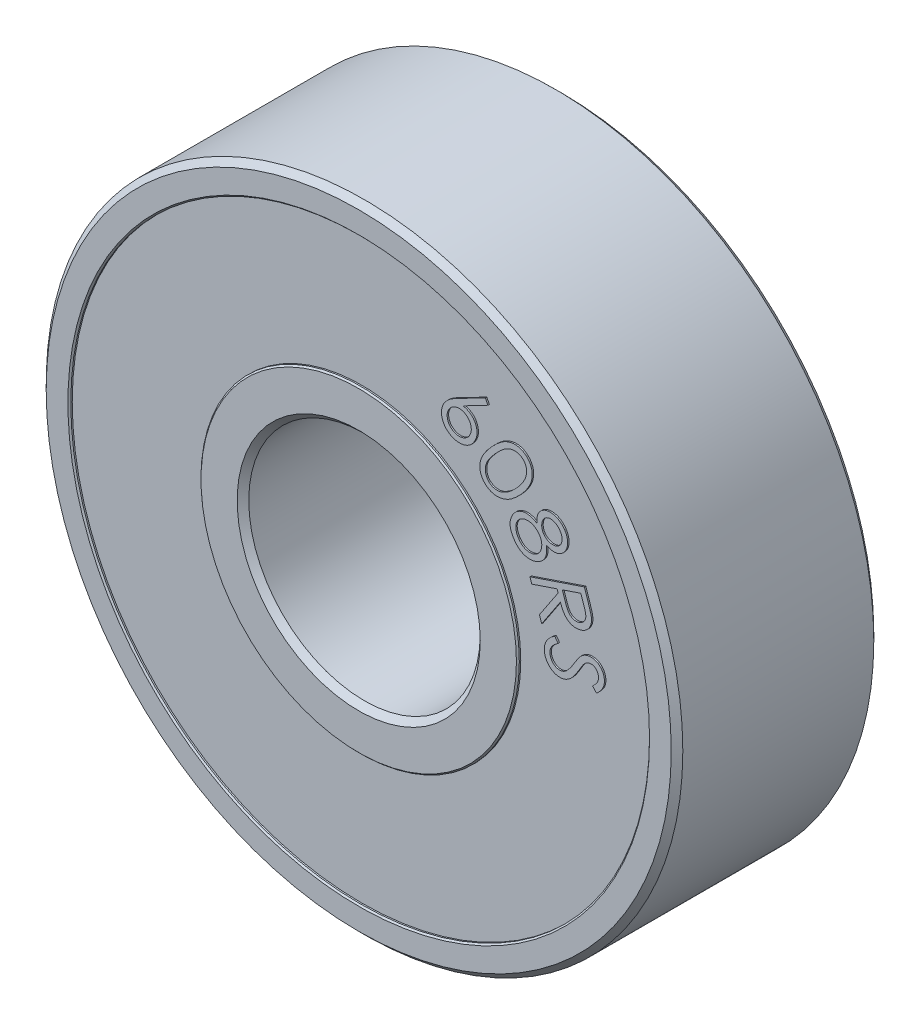
from build123d import *

# Parameters (mm, degrees)
SKETCH1_R           = 11
SKETCH1_R_2         = 4
BOSS_EXTRUDE1_DEPTH = 7
SKETCH2_R           = 10
SKETCH2_R_2         = 5.5
CUT_EXTRUDE1_DEPTH  = 0.1
CUT_EXTRUDE2_START  = -6.9
SKETCH2_2_R         = 10
SKETCH2_2_R_2       = 5.5
CUT_EXTRUDE2_DEPTH  = 0.1
CHAMFER1_SIZE       = 0.2
CHAMFER2_SIZE       = 0.05
BOSS_EXTRUDE2_DEPTH = 0.05
BOSS_EXTRUDE3_DEPTH = 0.05


with BuildPart() as part:
    # Sketch1 → Boss-Extrude1 (new body)
    with BuildSketch(Plane.XY):
        Circle(SKETCH1_R)
        Circle(SKETCH1_R_2, mode=Mode.SUBTRACT)
    extrude(amount=BOSS_EXTRUDE1_DEPTH)

    # Sketch2 → Cut-Extrude1 (cut)
    with BuildSketch(Plane.XY.offset(7)):
        Circle(SKETCH2_R)
        Circle(SKETCH2_R_2, mode=Mode.SUBTRACT)
    extrude(amount=-CUT_EXTRUDE1_DEPTH, mode=Mode.SUBTRACT)

    # Sketch2<2> → Cut-Extrude2 (cut)
    with BuildSketch(Plane.XY.offset(7).offset(CUT_EXTRUDE2_START)):
        Circle(SKETCH2_2_R)
        Circle(SKETCH2_2_R_2, mode=Mode.SUBTRACT)
    extrude(amount=-CUT_EXTRUDE2_DEPTH, mode=Mode.SUBTRACT)

    # Chamfer1
    chamfer1_edges = [part.edges().sort_by_distance(p)[0] for p in [
        (-4, 0, 0),
        (-4, 0, 7),
        (-11, 0, 7),
        (-11, 0, 0),
    ]]
    chamfer(chamfer1_edges, length=CHAMFER1_SIZE)

    # Chamfer2
    chamfer2_edges = [part.edges().sort_by_distance(p)[0] for p in [
        (-5.5, 0, 7),
        (-10, 0, 7),
        (-10, 0, 0),
        (-5.5, 0, 0),
    ]]
    chamfer(chamfer2_edges, length=CHAMFER2_SIZE)

    # Sketch3 → Boss-Extrude2 (add)
    # profile 1 of 5: a face of its own
    with BuildSketch(Plane(origin=(0, 0, 0.1), x_dir=(-1, 0, 0), z_dir=(0, 0, -1))):
        with BuildLine():
            Line((6.723953336, 1.374086402), (6.841741797, 1.216634479))
            add(Edge.make_bspline(
                [(6.841741797, 1.216634479), (6.817573288, 1.199359859), (6.771292818, 1.166280551), (6.7089583, 1.113159264), (6.65797847, 1.058354359), (6.616042027, 1.003718422), (6.585197602, 0.947642508), (6.564677897, 0.890789262), (6.554264641, 0.832905218), (6.556279326, 0.794387119), (6.557286669, 0.775128069)],
                knots=[0, 0, 0, 0, 1.292055059, 2.474166467, 3.555169481, 4.54276915, 5.463097752, 6.326728609, 7.163364304, 8, 8, 8, 8], degree=3))
            add(Edge.make_bspline(
                [(6.557286669, 0.775128069), (6.559589482, 0.75889953), (6.564156821, 0.726712276), (6.577499183, 0.679747808), (6.597073867, 0.635157474), (6.621192779, 0.592867963), (6.650084971, 0.554531373), (6.683420565, 0.521824686), (6.71962411, 0.494193194), (6.759139635, 0.472574946), (6.800541147, 0.456589651), (6.843001787, 0.446611622), (6.8860034, 0.441689172), (6.914655203, 0.443624683), (6.929081541, 0.444599223)],
                knots=[0, 0, 0, 0, 1.065647424, 2.113576877, 3.164384275, 4.227051853, 5.274981306, 6.276492859, 7.256630379, 8.228879028, 9.197081163, 10.13494145, 11.060932943, 12, 12, 12, 12], degree=3))
            add(Edge.make_bspline(
                [(6.929081541, 0.444599223), (6.945519436, 0.447087772), (6.978756008, 0.45211949), (7.026704444, 0.470689174), (7.073741901, 0.496394668), (7.101970562, 0.519552155), (7.116581541, 0.531538325)],
                knots=[0, 0, 0, 0, 0.947990027, 1.916786729, 2.921741833, 4, 4, 4, 4], degree=3))
            add(Edge.make_bspline(
                [(7.116581541, 0.531538325), (7.127135431, 0.541011836), (7.149222449, 0.560837855), (7.181222658, 0.595056366), (7.214764351, 0.633812728), (7.249572833, 0.677474782), (7.285307224, 0.726179014), (7.3219168, 0.780016687), (7.360652209, 0.838318589), (7.38569458, 0.879600754), (7.398632823, 0.900929351)],
                knots=[0, 0, 0, 0, 0.729441018, 1.526562937, 2.408317325, 3.366672661, 4.398852945, 5.515801495, 6.716528806, 8, 8, 8, 8], degree=3))
            add(Edge.make_bspline(
                [(7.398632823, 0.900929351), (7.411481182, 0.922096096), (7.436017587, 0.962518055), (7.472820572, 1.019379999), (7.50609449, 1.07074534), (7.537338687, 1.115557702), (7.565826722, 1.154147196), (7.591394823, 1.186795914), (7.614407064, 1.213420818), (7.629713327, 1.228338761), (7.636613592, 1.235063966)],
                knots=[0, 0, 0, 0, 1.445236574, 2.759956344, 3.953419532, 5.017350228, 5.948124348, 6.752849745, 7.43776821, 8, 8, 8, 8], degree=3))
            add(Edge.make_bspline(
                [(7.636613592, 1.235063966), (7.647453442, 1.244543907), (7.668850152, 1.263256302), (7.702463752, 1.288692966), (7.737555465, 1.310371795), (7.773613033, 1.328839241), (7.810780176, 1.344090457), (7.848714771, 1.356654507), (7.887907457, 1.365581106), (7.91448874, 1.368839266), (7.927879618, 1.370480633)],
                knots=[0, 0, 0, 0, 1.056756624, 2.085925105, 3.08957304, 4.080262677, 5.055903979, 6.035378084, 7.010280581, 8, 8, 8, 8], degree=3))
            add(Edge.make_bspline(
                [(7.927879618, 1.370480633), (7.948981269, 1.371870248), (7.990587385, 1.37461015), (8.052279005, 1.368496586), (8.111981804, 1.355515205), (8.168798048, 1.333504491), (8.222511066, 1.304967414), (8.271642008, 1.26880591), (8.315398275, 1.225611054), (8.35382237, 1.176261797), (8.385992991, 1.122092785), (8.41166226, 1.064244335), (8.429536588, 1.002885194), (8.435353033, 0.960458902), (8.438296284, 0.938990248)],
                knots=[0, 0, 0, 0, 1.01991207, 2.010960161, 2.982781706, 3.962746851, 4.943984954, 5.912890685, 6.898148972, 7.904611514, 8.925685622, 9.933656005, 10.954383679, 12, 12, 12, 12], degree=3))
            add(Edge.make_bspline(
                [(8.438296284, 0.938990248), (8.439905173, 0.916018968), (8.443100643, 0.870394895), (8.435954309, 0.802226976), (8.421251944, 0.735375989), (8.401131857, 0.681031699), (8.37977872, 0.638088379), (8.360564, 0.604548729), (8.337040201, 0.570775496), (8.310670734, 0.53558058), (8.279863744, 0.500254418), (8.246489716, 0.463106616), (8.208609747, 0.426121993), (8.181946924, 0.401530075), (8.168264233, 0.38891012)],
                knots=[0, 0, 0, 0, 1.294867467, 2.571782184, 3.843746611, 5.143215914, 5.822746795, 6.543964101, 7.318006915, 8.13942962, 9.019769218, 9.956863672, 10.951513765, 12, 12, 12, 12], degree=3))
            Line((8.168264233, 0.38891012), (8.029642438, 0.537547941))
            add(Edge.make_bspline(
                [(8.029642438, 0.537547941), (8.040491364, 0.547797716), (8.061430909, 0.567580842), (8.091198861, 0.596726402), (8.1177117, 0.624750316), (8.140998798, 0.651703899), (8.161430413, 0.677149832), (8.178807729, 0.701361339), (8.193307277, 0.724006553), (8.208313949, 0.752376209), (8.222111687, 0.78797107), (8.232490263, 0.831773931), (8.237254627, 0.876823898), (8.235338696, 0.906937777), (8.234370002, 0.922163325)],
                knots=[0, 0, 0, 0, 1.182699611, 2.282732375, 3.300866298, 4.238668036, 5.104698929, 5.88587987, 6.599324344, 7.233663973, 8.426546453, 9.612413994, 10.792838817, 12, 12, 12, 12], degree=3))
            add(Edge.make_bspline(
                [(8.234370002, 0.922163325), (8.231544844, 0.941132772), (8.226095153, 0.97772457), (8.207511221, 1.029103552), (8.179226125, 1.07342249), (8.143481188, 1.110786437), (8.101919482, 1.139998909), (8.056290048, 1.160326247), (8.006902954, 1.169811767), (7.973443836, 1.168186943), (7.956325131, 1.167355633)],
                knots=[0, 0, 0, 0, 1.109513479, 2.140235993, 3.138523126, 4.134648421, 5.117916045, 6.063936821, 7.00945106, 8, 8, 8, 8], degree=3))
            add(Edge.make_bspline(
                [(7.956325131, 1.167355633), (7.945745182, 1.165793238), (7.92452439, 1.162659454), (7.893216116, 1.154810012), (7.863019919, 1.142853978), (7.833191485, 1.128051735), (7.803915641, 1.108026169), (7.773495168, 1.083650001), (7.743435661, 1.052289809), (7.723571823, 1.029230065), (7.713136028, 1.017115248)],
                knots=[0, 0, 0, 0, 0.872627401, 1.750277355, 2.626708255, 3.518723759, 4.461878059, 5.515567722, 6.694762481, 8, 8, 8, 8], degree=3))
            add(Edge.make_bspline(
                [(7.713136028, 1.017115248), (7.709759885, 1.012601252), (7.701657657, 1.00176835), (7.688608104, 0.982001066), (7.672276268, 0.956433232), (7.65262288, 0.924978085), (7.629276842, 0.887948617), (7.60342511, 0.84439932), (7.573757222, 0.795347482), (7.552995234, 0.760582288), (7.54206231, 0.742275505)],
                knots=[0, 0, 0, 0, 0.417704147, 1.002426291, 1.754721007, 2.666443671, 3.751275867, 4.998903859, 6.419671761, 8, 8, 8, 8], degree=3))
            add(Edge.make_bspline(
                [(7.54206231, 0.742275505), (7.528720878, 0.72014766), (7.502869753, 0.677271475), (7.462909444, 0.616494005), (7.424908705, 0.560118495), (7.386533341, 0.509633022), (7.349495907, 0.463846731), (7.313037636, 0.423278472), (7.277439614, 0.387815365), (7.231706317, 0.348414155), (7.174122265, 0.307697522), (7.102778014, 0.269865497), (7.029575045, 0.243643782), (6.979473401, 0.23602383), (6.954722566, 0.232259479)],
                knots=[0, 0, 0, 0, 1.151589416, 2.231385892, 3.241866087, 4.181198595, 5.056967968, 5.86622306, 6.611257172, 7.295010099, 8.555133183, 9.745337415, 10.8861687, 12, 12, 12, 12], degree=3))
            add(Edge.make_bspline(
                [(6.954722566, 0.232259479), (6.937104145, 0.230954156), (6.902273291, 0.228373588), (6.850287945, 0.230996996), (6.799553841, 0.238604602), (6.7498888, 0.251362609), (6.70178582, 0.270191913), (6.654518449, 0.293243368), (6.609132064, 0.322693373), (6.565113537, 0.35621304), (6.524107945, 0.393956855), (6.487534332, 0.434933646), (6.45562657, 0.478557564), (6.428202178, 0.524760922), (6.405676349, 0.573922386), (6.388114701, 0.625763552), (6.37509852, 0.680239147), (6.370249322, 0.717645223), (6.367783464, 0.73666653)],
                knots=[0, 0, 0, 0, 0.985637329, 1.948562123, 2.898699275, 3.846375535, 4.804641011, 5.778360361, 6.777444169, 7.819911255, 8.864722404, 9.88397061, 10.881717925, 11.877903731, 12.878850076, 13.895148367, 14.929665032, 16, 16, 16, 16], degree=3))
            add(Edge.make_bspline(
                [(6.367783464, 0.73666653), (6.366427586, 0.751479961), (6.36374365, 0.780802889), (6.364781078, 0.824712107), (6.366958187, 0.867892434), (6.373888092, 0.910243045), (6.38267062, 0.952061727), (6.395985544, 0.99277455), (6.410879198, 1.033227048), (6.430041569, 1.072638466), (6.452506534, 1.111705681), (6.479103013, 1.150236727), (6.509821859, 1.188344837), (6.544257517, 1.226550474), (6.583270723, 1.264064543), (6.626226549, 1.301327262), (6.673295047, 1.338362343), (6.706747289, 1.361952754), (6.723953336, 1.374086402)],
                knots=[0, 0, 0, 0, 0.924783812, 1.830593555, 2.729938474, 3.612542721, 4.497647048, 5.385983185, 6.274940971, 7.178116819, 8.108855036, 9.07694148, 10.087910257, 11.152769032, 12.275211649, 13.45327497, 14.690100631, 16, 16, 16, 16], degree=3))
        make_face()
    # profile 2 of 5: a face of its own
    with BuildSketch(Plane(origin=(0, 0, 0.1), x_dir=(-1, 0, 0), z_dir=(0, 0, -1))):
        with BuildLine():
            Line((7.746137114, 3.357649879), (7.872739678, 2.983451161))
            add(Edge.make_bspline(
                [(7.872739678, 2.983451161), (7.881059185, 2.958357449), (7.896967784, 2.910373143), (7.919192418, 2.841249827), (7.93827157, 2.778162874), (7.954988951, 2.721116942), (7.968277975, 2.670083531), (7.97810167, 2.624967975), (7.986304921, 2.586220173), (7.989206196, 2.562134117), (7.99052814, 2.551159494)],
                knots=[0, 0, 0, 0, 1.41401025, 2.703876705, 3.883389485, 4.939117467, 5.883308228, 6.703003456, 7.409033675, 8, 8, 8, 8], degree=3))
            add(Edge.make_bspline(
                [(7.99052814, 2.551159494), (7.991680371, 2.536346044), (7.993961878, 2.507014281), (7.99355178, 2.463189389), (7.989536296, 2.420458725), (7.982244147, 2.378807362), (7.971867446, 2.338150413), (7.957859366, 2.298427821), (7.940049121, 2.259949253), (7.919392559, 2.222682043), (7.895267023, 2.187520322), (7.868522083, 2.15435442), (7.838146422, 2.124526727), (7.805654899, 2.096319063), (7.769505392, 2.071821996), (7.730676725, 2.049581161), (7.689074117, 2.029824145), (7.65969703, 2.019263938), (7.644774935, 2.013899879)],
                knots=[0, 0, 0, 0, 1.027353843, 2.034239082, 3.026914782, 3.992754084, 4.956116645, 5.926055136, 6.901519887, 7.885736109, 8.869562139, 9.847691085, 10.827432488, 11.810304063, 12.819812835, 13.841795782, 14.903739854, 16, 16, 16, 16], degree=3))
            add(Edge.make_bspline(
                [(7.644774935, 2.013899879), (7.619571721, 2.006225956), (7.570483848, 1.991279587), (7.495245456, 1.981482942), (7.421726968, 1.981550073), (7.350113043, 1.99285135), (7.28164526, 2.01459628), (7.217050526, 2.046407449), (7.157909987, 2.089546729), (7.111856988, 2.132170274), (7.078246075, 2.172604827), (7.052872874, 2.206693439), (7.028502864, 2.24470871), (7.00542963, 2.286885007), (6.981948203, 2.332291093), (6.960215509, 2.382102891), (6.938952909, 2.435460163), (6.925647847, 2.472458787), (6.918813396, 2.491463981)],
                knots=[0, 0, 0, 0, 1.278263464, 2.489652168, 3.670679834, 4.839936614, 5.997393751, 7.149490657, 8.321732671, 9.542815408, 10.187555536, 10.874109659, 11.606713321, 12.379429923, 13.209421677, 14.089665205, 15.018712606, 16, 16, 16, 16], degree=3))
            Line((6.918813396, 2.491463981), (6.274181986, 1.519909494))
            Line((6.274181986, 1.519909494), (6.195656345, 1.75268193))
            Line((6.195656345, 1.75268193), (6.840688396, 2.722633853))
            Line((6.840688396, 2.722633853), (6.804630704, 2.829605007))
            Line((6.804630704, 2.829605007), (5.931233268, 2.53393193))
            Line((5.931233268, 2.53393193), (5.867531345, 2.721832571))
            Line((5.867531345, 2.721832571), (7.746137114, 3.357649879))
        make_face()
        with BuildLine():
            Line((7.625944806, 3.107649879), (6.987323011, 2.891303725))
            Line((6.987323011, 2.891303725), (7.093893524, 2.567585776))
            add(Edge.make_bspline(
                [(7.093893524, 2.567585776), (7.099141602, 2.552460366), (7.109268083, 2.523274973), (7.12546665, 2.481526975), (7.141165795, 2.442969417), (7.157905934, 2.408224542), (7.173577508, 2.37635315), (7.19005439, 2.34833638), (7.206517147, 2.323717963), (7.228098548, 2.295648952), (7.257158343, 2.265709238), (7.296463649, 2.236869944), (7.338965987, 2.214103265), (7.38510297, 2.199047445), (7.432884658, 2.190547052), (7.481570808, 2.189590563), (7.530612026, 2.194710922), (7.562229046, 2.204464605), (7.578268524, 2.209412699)],
                knots=[0, 0, 0, 0, 1.118554581, 2.158318542, 3.128777667, 4.026236993, 4.852521549, 5.609511046, 6.2953485, 6.920617761, 8.081985124, 9.196171859, 10.314843201, 11.436157874, 12.572935431, 13.69304583, 14.829670183, 16, 16, 16, 16], degree=3))
            add(Edge.make_bspline(
                [(7.578268524, 2.209412699), (7.59342902, 2.215251964), (7.62342383, 2.226804859), (7.664579795, 2.251684726), (7.701464878, 2.282014563), (7.733367565, 2.317620085), (7.759719917, 2.357194019), (7.780045409, 2.399320856), (7.793065142, 2.44385535), (7.798012121, 2.482767203), (7.798617957, 2.516069958), (7.796430694, 2.544330853), (7.791830588, 2.575579595), (7.785411015, 2.609926292), (7.776957572, 2.647370858), (7.766058218, 2.687842945), (7.752740917, 2.731460489), (7.742856393, 2.761514748), (7.737723652, 2.777121033)],
                knots=[0, 0, 0, 0, 1.157480747, 2.290057996, 3.413820966, 4.554229024, 5.688088466, 6.796349954, 7.878911532, 8.984095935, 9.584534887, 10.253304793, 11.003966908, 11.837573395, 12.74613744, 13.742422656, 14.827707137, 16, 16, 16, 16], degree=3))
            Line((7.737723652, 2.777121033), (7.625944806, 3.107649879))
        make_face(mode=Mode.SUBTRACT)
    # profile 3 of 5: a face of its own
    with BuildSketch(Plane(origin=(0, 0, 0.1), x_dir=(-1, 0, 0), z_dir=(0, 0, -1))):
        with BuildLine():
            add(Edge.make_bspline(
                [(6.436645373, 3.958851709), (6.438849744, 3.940573746), (6.443153326, 3.904889774), (6.446080097, 3.852458084), (6.447345332, 3.802571834), (6.444615596, 3.755237655), (6.440242818, 3.710182835), (6.431945321, 3.667690701), (6.421801836, 3.627540907), (6.408467872, 3.589869698), (6.392118978, 3.554645749), (6.374421381, 3.520656156), (6.353059749, 3.489126668), (6.330588283, 3.458332588), (6.304473045, 3.429986163), (6.276658623, 3.402650225), (6.246016539, 3.377299569), (6.224148017, 3.36201487), (6.213087681, 3.354284402)],
                knots=[0, 0, 0, 0, 1.290890309, 2.520198396, 3.681805585, 4.788490099, 5.843551436, 6.853927339, 7.821726867, 8.74603337, 9.651448064, 10.544029729, 11.429902383, 12.319727641, 13.215057227, 14.129151139, 15.053789794, 16, 16, 16, 16], degree=3))
            add(Edge.make_bspline(
                [(6.213087681, 3.354284402), (6.197080539, 3.344144505), (6.165376402, 3.324061175), (6.115609733, 3.298721518), (6.064443052, 3.278646051), (6.012154311, 3.263322512), (5.958510855, 3.252871046), (5.903673026, 3.247212262), (5.847609117, 3.246868388), (5.810160039, 3.250090216), (5.791212681, 3.251720299)],
                knots=[0, 0, 0, 0, 1.02459754, 2.029343036, 3.015319328, 3.993724459, 4.972689464, 5.967517749, 6.971665777, 8, 8, 8, 8], degree=3))
            add(Edge.make_bspline(
                [(5.791212681, 3.251720299), (5.76812279, 3.255152686), (5.722105673, 3.26199328), (5.655371216, 3.282467937), (5.591465368, 3.310695655), (5.530691013, 3.347287029), (5.472409223, 3.391028314), (5.417139616, 3.44291569), (5.364964002, 3.502778785), (5.333693598, 3.547097948), (5.317654988, 3.569829274)],
                knots=[0, 0, 0, 0, 0.94927729, 1.891867025, 2.831441269, 3.787189233, 4.773456595, 5.792841766, 6.867947176, 8, 8, 8, 8], degree=3))
            add(Edge.make_bspline(
                [(5.317654988, 3.569829274), (5.303063571, 3.592276258), (5.274661246, 3.635969511), (5.240442419, 3.70396576), (5.213126694, 3.770723532), (5.193673612, 3.836759996), (5.18189304, 3.902041339), (5.177652501, 3.9664582), (5.181746591, 4.030123994), (5.193666901, 4.092147537), (5.210811163, 4.152011519), (5.232533781, 4.208453206), (5.257704373, 4.261497857), (5.287473484, 4.310315858), (5.320899663, 4.355598373), (5.358263051, 4.396995678), (5.399718813, 4.434649249), (5.43013903, 4.456340746), (5.445459476, 4.467265171)],
                knots=[0, 0, 0, 0, 1.265189782, 2.462703114, 3.593198436, 4.67234407, 5.711673085, 6.724080211, 7.71757927, 8.719632106, 9.70506986, 10.658584755, 11.576575664, 12.477685061, 13.358041525, 14.234425087, 15.110808649, 16, 16, 16, 16], degree=3))
            add(Edge.make_bspline(
                [(5.445459476, 4.467265171), (5.456987966, 4.474624406), (5.480000329, 4.489314395), (5.515649837, 4.508441139), (5.552366299, 4.524126629), (5.589327481, 4.537519912), (5.627481553, 4.547343512), (5.665928122, 4.555312832), (5.705401353, 4.558925918), (5.745399858, 4.560814177), (5.786673455, 4.559096182), (5.829078302, 4.554049573), (5.872697014, 4.544281293), (5.91778122, 4.532182679), (5.964098431, 4.515785424), (6.011833619, 4.496274612), (6.060588671, 4.472457347), (6.093098017, 4.454707355), (6.109722296, 4.445630556)],
                knots=[0, 0, 0, 0, 0.931334836, 1.859065266, 2.751202648, 3.648748233, 4.533436264, 5.43245535, 6.319384756, 7.229651734, 8.158095254, 9.129430785, 10.133761898, 11.19951572, 12.306952597, 13.477470392, 14.710056011, 16, 16, 16, 16], degree=3))
            add(Edge.make_bspline(
                [(6.109722296, 4.445630556), (6.107482301, 4.47205299), (6.10313889, 4.52328682), (6.107287375, 4.598282233), (6.11985051, 4.668288878), (6.14164351, 4.732865757), (6.171434346, 4.791786736), (6.208476731, 4.844446438), (6.252045054, 4.891203726), (6.28610488, 4.91622277), (6.303231911, 4.928803633)],
                knots=[0, 0, 0, 0, 1.159116483, 2.247558892, 3.275615725, 4.262372356, 5.218835671, 6.154236364, 7.07185513, 8, 8, 8, 8], degree=3))
            add(Edge.make_bspline(
                [(6.303231911, 4.928803633), (6.321754889, 4.940084937), (6.359014229, 4.962777505), (6.421256217, 4.986222737), (6.488036273, 5.000993457), (6.558445944, 5.007117844), (6.630670913, 5.005090507), (6.702669609, 4.992413163), (6.77329377, 4.969774079), (6.841463499, 4.937151075), (6.906181416, 4.896456921), (6.965941656, 4.848096386), (7.019799943, 4.792057066), (7.050247347, 4.749841495), (7.065651783, 4.72848312)],
                knots=[0, 0, 0, 0, 0.892779067, 1.795842916, 2.727080536, 3.70581188, 4.703144711, 5.698163754, 6.710047702, 7.752069251, 8.806330382, 9.855631886, 10.91508709, 12, 12, 12, 12], degree=3))
            add(Edge.make_bspline(
                [(7.065651783, 4.72848312), (7.079336383, 4.706774175), (7.106401224, 4.663839111), (7.136261198, 4.594226894), (7.157475004, 4.522286133), (7.168858659, 4.44845505), (7.171401759, 4.374581199), (7.164611604, 4.302250625), (7.148558493, 4.232231558), (7.122885922, 4.165630452), (7.089294662, 4.103906053), (7.0495902, 4.047721731), (7.002341174, 3.999113654), (6.966283703, 3.972535032), (6.948263963, 3.95925235)],
                knots=[0, 0, 0, 0, 1.068771019, 2.113771646, 3.146516798, 4.18939315, 5.220229497, 6.221594843, 7.210477599, 8.206485729, 9.188317762, 10.134173663, 11.067552274, 12, 12, 12, 12], degree=3))
            add(Edge.make_bspline(
                [(6.948263963, 3.95925235), (6.92948131, 3.947579211), (6.892704816, 3.924723167), (6.832726752, 3.900840341), (6.770949722, 3.886814804), (6.707208907, 3.88185386), (6.641795956, 3.887028294), (6.57452711, 3.90142974), (6.505301459, 3.925243395), (6.460060234, 3.947389739), (6.436645373, 3.958851709)],
                knots=[0, 0, 0, 0, 0.981875121, 1.922514633, 2.854567088, 3.789622669, 4.754286786, 5.76174218, 6.841576559, 8, 8, 8, 8], degree=3))
        make_face()
        with BuildLine():
            add(Edge.make_bspline(
                [(6.899786399, 4.627521581), (6.89206632, 4.638457323), (6.87685916, 4.659998761), (6.851731015, 4.689696603), (6.824543522, 4.715861262), (6.79632334, 4.739189166), (6.766173857, 4.759065259), (6.734647119, 4.775820377), (6.701543011, 4.789622008), (6.667263629, 4.799834203), (6.632827413, 4.807110393), (6.598864764, 4.810677554), (6.565845271, 4.811257308), (6.533573133, 4.808043896), (6.502305027, 4.801150813), (6.471895114, 4.791090338), (6.442508709, 4.777396374), (6.423983999, 4.765933971), (6.414610117, 4.760133761)],
                knots=[0, 0, 0, 0, 1.147797877, 2.260954539, 3.330167184, 4.38025149, 5.396817843, 6.421610434, 7.438370352, 8.467442645, 9.485040915, 10.452679454, 11.391973248, 12.312859485, 13.227240642, 14.132754951, 15.055135845, 16, 16, 16, 16], degree=3))
            add(Edge.make_bspline(
                [(6.414610117, 4.760133761), (6.405774199, 4.753786345), (6.388108367, 4.741095827), (6.364373565, 4.718498267), (6.343734102, 4.693036444), (6.324762197, 4.66560438), (6.309508042, 4.635122756), (6.296405059, 4.602338894), (6.286620035, 4.566820361), (6.27902636, 4.529487679), (6.274755334, 4.491152689), (6.273205383, 4.453199531), (6.276275975, 4.416049243), (6.282273469, 4.379861769), (6.29134367, 4.344469632), (6.304515391, 4.310097751), (6.320673305, 4.276359421), (6.334378057, 4.255189882), (6.341292809, 4.244508761)],
                knots=[0, 0, 0, 0, 0.908844192, 1.81707094, 2.729132775, 3.645761934, 4.599514883, 5.571907187, 6.593318126, 7.675011067, 8.753876802, 9.815092739, 10.84525358, 11.863975947, 12.879511735, 13.893573417, 14.937199413, 16, 16, 16, 16], degree=3))
            add(Edge.make_bspline(
                [(6.341292809, 4.244508761), (6.350814274, 4.231255034), (6.369827412, 4.204789049), (6.404691636, 4.170598056), (6.443344082, 4.140394154), (6.485652106, 4.115036742), (6.53091205, 4.095367527), (6.577788532, 4.082025189), (6.625777609, 4.074990316), (6.673984131, 4.075405122), (6.721007008, 4.080627131), (6.765184168, 4.092077638), (6.806448491, 4.107815252), (6.831074035, 4.122859441), (6.843296014, 4.130326068)],
                knots=[0, 0, 0, 0, 1.029778083, 2.056334151, 3.072742447, 4.125103068, 5.164692881, 6.18264204, 7.197261409, 8.21856438, 9.221531217, 10.179595353, 11.096509409, 12, 12, 12, 12], degree=3))
            add(Edge.make_bspline(
                [(6.843296014, 4.130326068), (6.851446438, 4.13616324), (6.867594435, 4.147728114), (6.88939698, 4.168131937), (6.90904658, 4.190508833), (6.92640353, 4.215277105), (6.941639015, 4.242075679), (6.954455745, 4.271261696), (6.965288178, 4.302452796), (6.973600755, 4.335686204), (6.979511889, 4.370209731), (6.980683648, 4.405777115), (6.977172407, 4.441591107), (6.970465098, 4.478043747), (6.9591051, 4.514969221), (6.943248573, 4.552252268), (6.923519635, 4.590151684), (6.907856867, 4.614813977), (6.899786399, 4.627521581)],
                knots=[0, 0, 0, 0, 0.860567069, 1.704995385, 2.558804371, 3.415153889, 4.298967395, 5.203031682, 6.150124742, 7.132495547, 8.143595732, 9.153914339, 10.17923786, 11.230179396, 12.333615959, 13.490750709, 14.707072956, 16, 16, 16, 16], degree=3))
        make_face(mode=Mode.SUBTRACT)
        with BuildLine():
            add(Edge.make_bspline(
                [(6.192654988, 4.141544017), (6.183073031, 4.155401294), (6.164227572, 4.182655302), (6.131187317, 4.218933327), (6.097015473, 4.252070626), (6.059989677, 4.280785033), (6.020837675, 4.305788703), (5.978908288, 4.326108106), (5.934953683, 4.342757084), (5.889255118, 4.354794419), (5.843074833, 4.363522847), (5.797427161, 4.366805064), (5.753115121, 4.366894985), (5.710232395, 4.361231726), (5.668413788, 4.352462102), (5.628232574, 4.337906769), (5.58882321, 4.320171181), (5.564407056, 4.304523989), (5.552029988, 4.296592094)],
                knots=[0, 0, 0, 0, 1.103096915, 2.169532516, 3.209705979, 4.22005898, 5.235178716, 6.249127762, 7.268541052, 8.31114268, 9.343069619, 10.344088993, 11.307028603, 12.241865975, 13.174241085, 14.101672058, 15.037697202, 16, 16, 16, 16], degree=3))
            add(Edge.make_bspline(
                [(5.552029988, 4.296592094), (5.53739373, 4.285920167), (5.508158373, 4.264603408), (5.470459325, 4.225147952), (5.438160928, 4.180583136), (5.411429753, 4.131524815), (5.391128257, 4.078821031), (5.379712135, 4.02334043), (5.375573245, 3.966204794), (5.379709706, 3.907692931), (5.391978104, 3.848519155), (5.411845955, 3.789219006), (5.439605058, 3.729865997), (5.463581076, 3.692173419), (5.475908194, 3.672794017)],
                knots=[0, 0, 0, 0, 0.926109246, 1.849867156, 2.780058085, 3.737943589, 4.703270699, 5.660960876, 6.627667837, 7.628486545, 8.654526651, 9.714225142, 10.824783286, 12, 12, 12, 12], degree=3))
            add(Edge.make_bspline(
                [(5.475908194, 3.672794017), (5.486060461, 3.658170197), (5.505883669, 3.629615884), (5.539352829, 3.591150094), (5.574498341, 3.557119283), (5.611193238, 3.52754691), (5.649610266, 3.502113814), (5.690285635, 3.482258235), (5.73254201, 3.466467844), (5.776087466, 3.455386323), (5.819965834, 3.44854851), (5.863310687, 3.446190652), (5.905570882, 3.447721693), (5.946649447, 3.453327605), (5.986515083, 3.463003588), (6.025261611, 3.476638949), (6.062787941, 3.494832298), (6.086485292, 3.509769369), (6.098504347, 3.517345299)],
                knots=[0, 0, 0, 0, 1.19035752, 2.32427924, 3.40484362, 4.459799014, 5.473418872, 6.48040078, 7.481219341, 8.486773131, 9.481309882, 10.447796045, 11.386669185, 12.306601008, 13.216804754, 14.126789189, 15.049926509, 16, 16, 16, 16], degree=3))
            add(Edge.make_bspline(
                [(6.098504347, 3.517345299), (6.109623379, 3.525413647), (6.131612455, 3.541369668), (6.161538623, 3.568937135), (6.18821179, 3.599437638), (6.210866349, 3.633334346), (6.230793072, 3.669716469), (6.247216973, 3.709047676), (6.259874558, 3.751393122), (6.269542145, 3.795841921), (6.274911413, 3.841443699), (6.276921551, 3.886781556), (6.273360853, 3.931306877), (6.266335015, 3.975088203), (6.254596548, 4.018173699), (6.238424813, 4.06039773), (6.21802423, 4.101939076), (6.201197342, 4.128208206), (6.192654988, 4.141544017)],
                knots=[0, 0, 0, 0, 0.942671861, 1.864234432, 2.78725575, 3.718123832, 4.657802721, 5.631928245, 6.638488188, 7.688830978, 8.751153965, 9.788000563, 10.799352584, 11.812407604, 12.828984143, 13.859322421, 14.913261601, 16, 16, 16, 16], degree=3))
        make_face(mode=Mode.SUBTRACT)
    # profile 4 of 5: a face of its own
    with BuildSketch(Plane(origin=(0, 0, 0.1), x_dir=(-1, 0, 0), z_dir=(0, 0, -1))):
        with BuildLine():
            add(Edge.make_bspline(
                [(4.543033426, 5.949335529), (4.564943157, 5.972693181), (4.607527355, 6.018091587), (4.67157506, 6.0821776), (4.733665606, 6.140505217), (4.794137626, 6.192741517), (4.85293655, 6.238729797), (4.909649751, 6.279135227), (4.964441144, 6.313866459), (5.018164906, 6.342452083), (5.070566701, 6.366205448), (5.122024451, 6.38603643), (5.172895525, 6.401712181), (5.223134838, 6.413290127), (5.272621026, 6.421532789), (5.321665929, 6.425568094), (5.370160168, 6.42549656), (5.417968316, 6.42189385), (5.464631842, 6.414853045), (5.509827437, 6.403785557), (5.553710443, 6.389848585), (5.596047144, 6.372253298), (5.636808987, 6.351171515), (5.676066811, 6.327121226), (5.714074787, 6.299926787), (5.737519741, 6.279144916), (5.749363554, 6.268646427)],
                knots=[0, 0, 0, 0, 1.642537938, 3.192470103, 4.646338539, 6.011168142, 7.289605298, 8.473669563, 9.581665276, 10.614373007, 11.59226402, 12.531086133, 13.441104306, 14.320069679, 15.173659948, 16.012137794, 16.84096325, 17.65841702, 18.469272155, 19.258427056, 20.042601694, 20.82874835, 21.606886513, 22.39398752, 23.188682081, 24, 24, 24, 24], degree=3))
            add(Edge.make_bspline(
                [(5.749363554, 6.268646427), (5.760911716, 6.257617316), (5.783832443, 6.2357268), (5.814606127, 6.199685182), (5.842763625, 6.162273296), (5.86720813, 6.122744115), (5.888632845, 6.081687155), (5.906688759, 6.038659944), (5.921436917, 5.993756214), (5.933125957, 5.947322605), (5.941123235, 5.899359884), (5.945576238, 5.850210478), (5.945937318, 5.799696325), (5.942178582, 5.748167993), (5.934948076, 5.695283356), (5.923723996, 5.64133292), (5.908257359, 5.586132596), (5.889035669, 5.529625786), (5.865374627, 5.471491833), (5.83582998, 5.412255968), (5.80126516, 5.351314775), (5.761491532, 5.288687708), (5.716170301, 5.224741752), (5.665349958, 5.159251463), (5.609380215, 5.092013278), (5.569231642, 5.047489171), (5.5486424, 5.024656042)],
                knots=[0, 0, 0, 0, 0.812736739, 1.613115341, 2.410193159, 3.195255584, 3.977011722, 4.766451224, 5.568648116, 6.381840011, 7.202505524, 8.042362829, 8.892510741, 9.771967907, 10.671265438, 11.608935862, 12.575845681, 13.588824347, 14.647177854, 15.769502049, 16.957239641, 18.213799721, 19.545973321, 20.947120805, 22.434403522, 24, 24, 24, 24], degree=3))
            add(Edge.make_bspline(
                [(5.5486424, 5.024656042), (5.527680493, 5.002353903), (5.486797486, 4.958856979), (5.424765374, 4.897538301), (5.363751907, 4.841756827), (5.304193874, 4.791136914), (5.245683972, 4.746127832), (5.188196251, 4.706632475), (5.131917607, 4.672564327), (5.076622511, 4.643827313), (5.022302089, 4.620150633), (4.968866404, 4.60056073), (4.916443523, 4.584153257), (4.864386266, 4.572744454), (4.813189003, 4.564345172), (4.762509713, 4.561020629), (4.712689965, 4.560768112), (4.663807528, 4.564917701), (4.616099552, 4.572413487), (4.569931105, 4.58374163), (4.525340014, 4.598193132), (4.482211508, 4.615751886), (4.440882307, 4.637302377), (4.400706003, 4.661523567), (4.362510463, 4.689746565), (4.338690087, 4.710774866), (4.326687272, 4.721370786)],
                knots=[0, 0, 0, 0, 1.559433233, 3.041436978, 4.443008781, 5.770818333, 7.022943957, 8.202580838, 9.32288808, 10.372875569, 11.375398524, 12.339881119, 13.271916542, 14.171621232, 15.053181812, 15.912749435, 16.756523382, 17.589472185, 18.409479342, 19.214872608, 20.008917662, 20.796169375, 21.584390954, 22.381462505, 23.184437513, 24, 24, 24, 24], degree=3))
            add(Edge.make_bspline(
                [(4.326687272, 4.721370786), (4.315260387, 4.732257291), (4.292582092, 4.753863126), (4.262524999, 4.789474989), (4.234216651, 4.825811541), (4.210591491, 4.864827354), (4.189388006, 4.905106752), (4.171852571, 4.947252998), (4.157409917, 4.991049596), (4.146081336, 5.036416821), (4.1385724, 5.083328133), (4.134475716, 5.131406743), (4.134526669, 5.180589449), (4.138668218, 5.230653261), (4.146378676, 5.281762522), (4.157589801, 5.333992266), (4.172890384, 5.387243797), (4.192316993, 5.44187928), (4.216511887, 5.49808747), (4.245828348, 5.556425299), (4.281385112, 5.616628969), (4.322888369, 5.67887757), (4.369244831, 5.744006213), (4.421956893, 5.810719564), (4.480129534, 5.879757147), (4.521656172, 5.925690016), (4.543033426, 5.949335529)],
                knots=[0, 0, 0, 0, 0.809667474, 1.606901415, 2.389915423, 3.171938179, 3.944739181, 4.725317868, 5.512374, 6.310580304, 7.123290289, 7.948912628, 8.785395908, 9.645186643, 10.525642855, 11.437417869, 12.385812245, 13.368196359, 14.41253519, 15.525600646, 16.717987141, 17.999697683, 19.365829755, 20.821103961, 22.363554732, 24, 24, 24, 24], degree=3))
        make_face()
        with BuildLine():
            add(Edge.make_bspline(
                [(4.679251375, 5.818325914), (4.660851677, 5.798119355), (4.625169821, 5.75893352), (4.575066406, 5.700527005), (4.530060028, 5.644381866), (4.490109119, 5.590608243), (4.454150268, 5.539934716), (4.423546398, 5.49144367), (4.398220443, 5.445165553), (4.377241144, 5.40129025), (4.35988931, 5.359114478), (4.347091963, 5.31763911), (4.335718979, 5.277328241), (4.328855361, 5.237439496), (4.323935339, 5.198395489), (4.323658489, 5.159929724), (4.324705927, 5.122099941), (4.332062828, 5.073644615), (4.346039936, 5.016229297), (4.372941953, 4.953168665), (4.40806014, 4.896592751), (4.438775126, 4.865487268), (4.454091118, 4.849976555)],
                knots=[0, 0, 0, 0, 1.475488141, 2.861359785, 4.154121984, 5.359730204, 6.477947551, 7.508249804, 8.453740252, 9.324547233, 10.133287385, 10.913161477, 11.667000762, 12.392548848, 13.096455606, 13.788819075, 14.467224618, 15.137185669, 16.431314552, 17.646052312, 18.826206712, 20, 20, 20, 20], degree=3))
            add(Edge.make_bspline(
                [(4.454091118, 4.849976555), (4.470998304, 4.835844543), (4.504676122, 4.807694658), (4.563731671, 4.776736661), (4.628146618, 4.755513764), (4.685580759, 4.74573126), (4.73346006, 4.743796713), (4.770607522, 4.744784191), (4.808256766, 4.749765726), (4.846476655, 4.7579731), (4.885356808, 4.768707571), (4.924789742, 4.782747964), (4.964461886, 4.800624278), (4.990744591, 4.814196805), (5.004171247, 4.821130401)],
                knots=[0, 0, 0, 0, 1.34190696, 2.672975875, 4.03914862, 5.469008549, 6.211498008, 6.961821166, 7.734266787, 8.525620103, 9.346360653, 10.194610762, 11.077707539, 12, 12, 12, 12], degree=3))
            add(Edge.make_bspline(
                [(5.004171247, 4.821130401), (5.020977638, 4.830421862), (5.055134219, 4.849305423), (5.105185594, 4.881764095), (5.155673749, 4.917150584), (5.205669506, 4.95682755), (5.256454512, 4.999267098), (5.306984725, 5.045647846), (5.35784608, 5.095550455), (5.390788359, 5.130831575), (5.407616759, 5.14885476)],
                knots=[0, 0, 0, 0, 0.882398032, 1.79334748, 2.740232888, 3.715191852, 4.725879822, 5.7816566, 6.866770249, 8, 8, 8, 8], degree=3))
            add(Edge.make_bspline(
                [(5.407616759, 5.14885476), (5.424180747, 5.167029522), (5.45658333, 5.202583114), (5.501733152, 5.256702416), (5.543098053, 5.309660342), (5.58077131, 5.361374876), (5.615025998, 5.411615164), (5.644765307, 5.461224488), (5.670823679, 5.509629921), (5.693361068, 5.556938809), (5.712272001, 5.603065203), (5.727612485, 5.647874505), (5.739126559, 5.691583045), (5.748400632, 5.733736142), (5.752834323, 5.774825331), (5.755220583, 5.814429798), (5.753676352, 5.852830865), (5.746508693, 5.901432573), (5.732173642, 5.958555869), (5.706135375, 6.021663456), (5.67073215, 6.07767327), (5.640308497, 6.108613984), (5.625164836, 6.124015016)],
                knots=[0, 0, 0, 0, 1.327465575, 2.596797036, 3.803974219, 4.954802096, 6.050653377, 7.085610932, 8.075932289, 9.017660852, 9.913387465, 10.766122373, 11.572387875, 12.35293663, 13.093430198, 13.800930815, 14.493692928, 15.163603914, 16.450647312, 17.662487793, 18.836481221, 20, 20, 20, 20], degree=3))
            add(Edge.make_bspline(
                [(5.625164836, 6.124015016), (5.608285103, 6.138200877), (5.574619324, 6.166493862), (5.514977812, 6.196712457), (5.450201973, 6.218295255), (5.392180613, 6.227466046), (5.343795213, 6.230492325), (5.306274605, 6.228545799), (5.268394949, 6.224194501), (5.229871713, 6.21704111), (5.190985821, 6.205984316), (5.151532352, 6.192011613), (5.111544201, 6.174986568), (5.070779705, 6.154839157), (5.028631981, 6.130550497), (4.984923072, 6.100987844), (4.939041603, 6.06649501), (4.89071745, 6.027165691), (4.840939904, 5.982142624), (4.788729648, 5.932288445), (4.734224356, 5.877502417), (4.697964293, 5.838469719), (4.679251375, 5.818325914)],
                knots=[0, 0, 0, 0, 1.186933895, 2.367280006, 3.582519422, 4.861472594, 5.525769364, 6.196917143, 6.886441279, 7.583575583, 8.309531112, 9.066613021, 9.841978912, 10.654534034, 11.520211795, 12.46606624, 13.501419929, 14.618477826, 15.828573167, 17.123883194, 18.515707565, 20, 20, 20, 20], degree=3))
        make_face(mode=Mode.SUBTRACT)
    # profile 5 of 5: a face of its own
    with BuildSketch(Plane(origin=(0, 0, 0.1), x_dir=(-1, 0, 0), z_dir=(0, 0, -1))):
        with BuildLine():
            Line((4.324964443, 7.302356675), (4.416310597, 7.130481675))
            Line((4.416310597, 7.130481675), (3.555733674, 6.680962444))
            add(Edge.make_bspline(
                [(3.555733674, 6.680962444), (3.573820412, 6.677343593), (3.609234202, 6.670257891), (3.660020503, 6.655631802), (3.706959766, 6.637037992), (3.736127944, 6.622159713), (3.750445212, 6.614856675)],
                knots=[0, 0, 0, 0, 1.071524611, 2.098042594, 3.06641979, 4, 4, 4, 4], degree=3))
            add(Edge.make_bspline(
                [(3.750445212, 6.614856675), (3.767080526, 6.605028081), (3.79973166, 6.585736909), (3.844667082, 6.551553291), (3.885064799, 6.513987171), (3.921262857, 6.472864589), (3.951945795, 6.427668961), (3.978773631, 6.379220739), (4.000582274, 6.327012973), (4.018191547, 6.272085969), (4.030461657, 6.21560422), (4.037588265, 6.158731496), (4.038082899, 6.102220894), (4.033932701, 6.045949965), (4.023286554, 5.990142073), (4.007124801, 5.934646585), (3.985547474, 5.879431036), (3.966999274, 5.843995875), (3.957576622, 5.825994495)],
                knots=[0, 0, 0, 0, 1.019907112, 2.001833211, 2.975106465, 3.930005657, 4.888753167, 5.854816606, 6.850530802, 7.872265815, 8.897525529, 9.899342728, 10.89405696, 11.877628612, 12.875140218, 13.888660536, 14.927420607, 16, 16, 16, 16], degree=3))
            add(Edge.make_bspline(
                [(3.957576622, 5.825994495), (3.943401003, 5.802045015), (3.915487215, 5.75488512), (3.862951089, 5.692675141), (3.804519394, 5.638220775), (3.739385216, 5.593013878), (3.669307026, 5.556735668), (3.594664605, 5.530879797), (3.516222355, 5.515258034), (3.435036911, 5.509786674), (3.353146288, 5.514458347), (3.272777466, 5.529881756), (3.194647085, 5.555414913), (3.145724036, 5.580276576), (3.121038161, 5.592821418)],
                knots=[0, 0, 0, 0, 1.033065496, 2.034251297, 3.014475546, 3.995102051, 4.972102283, 5.939302282, 6.921736905, 7.936931798, 8.956451458, 9.962291878, 10.971801474, 12, 12, 12, 12], degree=3))
            add(Edge.make_bspline(
                [(3.121038161, 5.592821418), (3.098026879, 5.606472481), (3.0524791, 5.633492949), (2.992288878, 5.684987892), (2.938815288, 5.742646167), (2.893091356, 5.807005676), (2.856848611, 5.877071666), (2.829822579, 5.95090171), (2.814390825, 6.028443749), (2.808805845, 6.108143214), (2.813547075, 6.188295134), (2.828636553, 6.266552303), (2.852811134, 6.342529378), (2.87690699, 6.389852952), (2.889067007, 6.41373488)],
                knots=[0, 0, 0, 0, 1.012372306, 2.003856587, 2.988821669, 3.987270143, 4.9855775, 5.970178416, 6.956819527, 7.971542281, 8.990660658, 9.990237353, 10.98576963, 12, 12, 12, 12], degree=3))
            add(Edge.make_bspline(
                [(2.889067007, 6.41373488), (2.899540358, 6.431325076), (2.920940833, 6.467267588), (2.960198132, 6.517770314), (3.004943495, 6.567060495), (3.056853524, 6.615148364), (3.117971201, 6.662922917), (3.190061184, 6.711153599), (3.273543427, 6.760845263), (3.334013557, 6.792508176), (3.365829827, 6.809167572)],
                knots=[0, 0, 0, 0, 0.780869162, 1.595570546, 2.436441551, 3.320231236, 4.29319985, 5.394687772, 6.629218754, 8, 8, 8, 8], degree=3))
            Line((3.365829827, 6.809167572), (4.324964443, 7.302356675))
        make_face()
        with BuildLine():
            add(Edge.make_bspline(
                [(3.625044571, 6.485850264), (3.61246774, 6.492363366), (3.587793416, 6.505141338), (3.549283998, 6.520055204), (3.510411292, 6.531042293), (3.47074979, 6.537397013), (3.430752873, 6.539819896), (3.390231954, 6.538126728), (3.349267971, 6.532580911), (3.30840025, 6.522524522), (3.268684526, 6.508902031), (3.230704875, 6.492745024), (3.195685684, 6.472411), (3.163091352, 6.449070139), (3.13272335, 6.422628438), (3.105710691, 6.392249296), (3.080338604, 6.359286415), (3.066163338, 6.335110707), (3.058938802, 6.322789367)],
                knots=[0, 0, 0, 0, 1.036538255, 2.033571136, 3.018249213, 3.98933273, 4.969044784, 5.947780153, 6.95464472, 7.991182975, 9.024116511, 10.027031361, 11.00835282, 11.982631912, 12.959655734, 13.949709709, 14.955053332, 16, 16, 16, 16], degree=3))
            add(Edge.make_bspline(
                [(3.058938802, 6.322789367), (3.052424832, 6.310212609), (3.039645159, 6.28553843), (3.024743633, 6.247027964), (3.013710803, 6.208159143), (3.007523505, 6.168474735), (3.004467656, 6.128522842), (3.006132907, 6.087928786), (3.012460373, 6.047110429), (3.02173914, 6.006096324), (3.035393603, 5.966315568), (3.05221016, 5.928670302), (3.071880169, 5.893304629), (3.095339468, 5.860838927), (3.121746631, 5.830604201), (3.151755643, 5.803329461), (3.184551656, 5.778180829), (3.208612752, 5.764176376), (3.220797776, 5.757084239)],
                knots=[0, 0, 0, 0, 1.037953187, 2.036347074, 3.022369291, 3.994778392, 4.976462996, 5.956534394, 6.96615164, 8.001838703, 9.036182251, 10.044421244, 11.022239489, 11.997848527, 12.976206041, 13.960378582, 14.967094555, 16, 16, 16, 16], degree=3))
            add(Edge.make_bspline(
                [(3.220797776, 5.757084239), (3.233377904, 5.750582598), (3.258058696, 5.737827114), (3.296488373, 5.722763061), (3.335498991, 5.712383777), (3.374971571, 5.706056766), (3.414930952, 5.70302077), (3.455396792, 5.704628759), (3.496203169, 5.71105302), (3.537088515, 5.720284736), (3.576879413, 5.733924196), (3.614591623, 5.750863843), (3.650196609, 5.770325323), (3.682745964, 5.793747685), (3.712577884, 5.820567455), (3.740297359, 5.850138565), (3.765381679, 5.883121331), (3.779402485, 5.907166762), (3.786502904, 5.919343854)],
                knots=[0, 0, 0, 0, 1.038237759, 2.036905372, 3.020616447, 3.993292149, 4.965474482, 5.955602401, 6.955806131, 7.991777144, 9.026404274, 10.034919693, 11.021552688, 11.997429205, 12.968722844, 13.959819387, 14.966811367, 16, 16, 16, 16], degree=3))
            add(Edge.make_bspline(
                [(3.786502904, 5.919343854), (3.793042375, 5.931909999), (3.805987221, 5.956784611), (3.820573205, 5.99569852), (3.831638485, 6.034937419), (3.838525134, 6.074539053), (3.840844134, 6.11470636), (3.839232802, 6.155095551), (3.833585246, 6.196048891), (3.823580038, 6.236788916), (3.809963735, 6.276508839), (3.793718376, 6.314578155), (3.773506953, 6.34968447), (3.750705692, 6.382621156), (3.72391794, 6.412312718), (3.694115201, 6.439628378), (3.661283282, 6.464747606), (3.637227105, 6.478756087), (3.625044571, 6.485850264)],
                knots=[0, 0, 0, 0, 1.036883605, 2.052505109, 3.037511257, 4.020182804, 4.990456222, 5.979292736, 6.976801729, 8.013685334, 9.04696302, 10.050212019, 11.040354247, 12.009295177, 12.979321976, 13.962480355, 14.968158935, 16, 16, 16, 16], degree=3))
        make_face(mode=Mode.SUBTRACT)
    extrude(amount=BOSS_EXTRUDE2_DEPTH)

    # Sketch4 → Boss-Extrude3 (add)
    # profile 1 of 5: a face of its own
    with BuildSketch(Plane.XY.offset(6.9)):
        with BuildLine():
            Line((6.723953336, 1.374086402), (6.841741797, 1.216634479))
            add(Edge.make_bspline(
                [(6.841741797, 1.216634479), (6.817573288, 1.199359859), (6.771292818, 1.166280551), (6.7089583, 1.113159264), (6.65797847, 1.058354359), (6.616042027, 1.003718422), (6.585197602, 0.947642508), (6.564677897, 0.890789262), (6.554264641, 0.832905218), (6.556279326, 0.794387119), (6.557286669, 0.775128069)],
                knots=[0, 0, 0, 0, 1.292055059, 2.474166467, 3.555169481, 4.54276915, 5.463097752, 6.326728609, 7.163364304, 8, 8, 8, 8], degree=3))
            add(Edge.make_bspline(
                [(6.557286669, 0.775128069), (6.559589482, 0.75889953), (6.564156821, 0.726712276), (6.577499183, 0.679747808), (6.597073867, 0.635157474), (6.621192779, 0.592867963), (6.650084971, 0.554531373), (6.683420565, 0.521824686), (6.71962411, 0.494193194), (6.759139635, 0.472574946), (6.800541147, 0.456589651), (6.843001787, 0.446611622), (6.8860034, 0.441689172), (6.914655203, 0.443624683), (6.929081541, 0.444599223)],
                knots=[0, 0, 0, 0, 1.065647424, 2.113576877, 3.164384275, 4.227051853, 5.274981306, 6.276492859, 7.256630379, 8.228879028, 9.197081163, 10.13494145, 11.060932943, 12, 12, 12, 12], degree=3))
            add(Edge.make_bspline(
                [(6.929081541, 0.444599223), (6.945519436, 0.447087772), (6.978756008, 0.45211949), (7.026704444, 0.470689174), (7.073741901, 0.496394668), (7.101970562, 0.519552155), (7.116581541, 0.531538325)],
                knots=[0, 0, 0, 0, 0.947990027, 1.916786729, 2.921741833, 4, 4, 4, 4], degree=3))
            add(Edge.make_bspline(
                [(7.116581541, 0.531538325), (7.127135431, 0.541011836), (7.149222449, 0.560837855), (7.181222658, 0.595056366), (7.214764351, 0.633812728), (7.249572833, 0.677474782), (7.285307224, 0.726179014), (7.3219168, 0.780016687), (7.360652209, 0.838318589), (7.38569458, 0.879600754), (7.398632823, 0.900929351)],
                knots=[0, 0, 0, 0, 0.729441018, 1.526562937, 2.408317325, 3.366672661, 4.398852945, 5.515801495, 6.716528806, 8, 8, 8, 8], degree=3))
            add(Edge.make_bspline(
                [(7.398632823, 0.900929351), (7.411481182, 0.922096096), (7.436017587, 0.962518055), (7.472820572, 1.019379999), (7.50609449, 1.07074534), (7.537338687, 1.115557702), (7.565826722, 1.154147196), (7.591394823, 1.186795914), (7.614407064, 1.213420818), (7.629713327, 1.228338761), (7.636613592, 1.235063966)],
                knots=[0, 0, 0, 0, 1.445236574, 2.759956344, 3.953419532, 5.017350228, 5.948124348, 6.752849745, 7.43776821, 8, 8, 8, 8], degree=3))
            add(Edge.make_bspline(
                [(7.636613592, 1.235063966), (7.647453442, 1.244543907), (7.668850152, 1.263256302), (7.702463752, 1.288692966), (7.737555465, 1.310371795), (7.773613033, 1.328839241), (7.810780176, 1.344090457), (7.848714771, 1.356654507), (7.887907457, 1.365581106), (7.91448874, 1.368839266), (7.927879618, 1.370480633)],
                knots=[0, 0, 0, 0, 1.056756624, 2.085925105, 3.08957304, 4.080262677, 5.055903979, 6.035378084, 7.010280581, 8, 8, 8, 8], degree=3))
            add(Edge.make_bspline(
                [(7.927879618, 1.370480633), (7.948981269, 1.371870248), (7.990587385, 1.37461015), (8.052279005, 1.368496586), (8.111981804, 1.355515205), (8.168798048, 1.333504491), (8.222511066, 1.304967414), (8.271642008, 1.26880591), (8.315398275, 1.225611054), (8.35382237, 1.176261797), (8.385992991, 1.122092785), (8.41166226, 1.064244335), (8.429536588, 1.002885194), (8.435353033, 0.960458902), (8.438296284, 0.938990248)],
                knots=[0, 0, 0, 0, 1.01991207, 2.010960161, 2.982781706, 3.962746851, 4.943984954, 5.912890685, 6.898148972, 7.904611514, 8.925685622, 9.933656005, 10.954383679, 12, 12, 12, 12], degree=3))
            add(Edge.make_bspline(
                [(8.438296284, 0.938990248), (8.439905173, 0.916018968), (8.443100643, 0.870394895), (8.435954309, 0.802226976), (8.421251944, 0.735375989), (8.401131857, 0.681031699), (8.37977872, 0.638088379), (8.360564, 0.604548729), (8.337040201, 0.570775496), (8.310670734, 0.53558058), (8.279863744, 0.500254418), (8.246489716, 0.463106616), (8.208609747, 0.426121993), (8.181946924, 0.401530075), (8.168264233, 0.38891012)],
                knots=[0, 0, 0, 0, 1.294867467, 2.571782184, 3.843746611, 5.143215914, 5.822746795, 6.543964101, 7.318006915, 8.13942962, 9.019769218, 9.956863672, 10.951513765, 12, 12, 12, 12], degree=3))
            Line((8.168264233, 0.38891012), (8.029642438, 0.537547941))
            add(Edge.make_bspline(
                [(8.029642438, 0.537547941), (8.040491364, 0.547797716), (8.061430909, 0.567580842), (8.091198861, 0.596726402), (8.1177117, 0.624750316), (8.140998798, 0.651703899), (8.161430413, 0.677149832), (8.178807729, 0.701361339), (8.193307277, 0.724006553), (8.208313949, 0.752376209), (8.222111687, 0.78797107), (8.232490263, 0.831773931), (8.237254627, 0.876823898), (8.235338696, 0.906937777), (8.234370002, 0.922163325)],
                knots=[0, 0, 0, 0, 1.182699611, 2.282732375, 3.300866298, 4.238668036, 5.104698929, 5.88587987, 6.599324344, 7.233663973, 8.426546453, 9.612413994, 10.792838817, 12, 12, 12, 12], degree=3))
            add(Edge.make_bspline(
                [(8.234370002, 0.922163325), (8.231544844, 0.941132772), (8.226095153, 0.97772457), (8.207511221, 1.029103552), (8.179226125, 1.07342249), (8.143481188, 1.110786437), (8.101919482, 1.139998909), (8.056290048, 1.160326247), (8.006902954, 1.169811767), (7.973443836, 1.168186943), (7.956325131, 1.167355633)],
                knots=[0, 0, 0, 0, 1.109513479, 2.140235993, 3.138523126, 4.134648421, 5.117916045, 6.063936821, 7.00945106, 8, 8, 8, 8], degree=3))
            add(Edge.make_bspline(
                [(7.956325131, 1.167355633), (7.945745182, 1.165793238), (7.92452439, 1.162659454), (7.893216116, 1.154810012), (7.863019919, 1.142853978), (7.833191485, 1.128051735), (7.803915641, 1.108026169), (7.773495168, 1.083650001), (7.743435661, 1.052289809), (7.723571823, 1.029230065), (7.713136028, 1.017115248)],
                knots=[0, 0, 0, 0, 0.872627401, 1.750277355, 2.626708255, 3.518723759, 4.461878059, 5.515567722, 6.694762481, 8, 8, 8, 8], degree=3))
            add(Edge.make_bspline(
                [(7.713136028, 1.017115248), (7.709759885, 1.012601252), (7.701657657, 1.00176835), (7.688608104, 0.982001066), (7.672276268, 0.956433232), (7.65262288, 0.924978085), (7.629276842, 0.887948617), (7.60342511, 0.84439932), (7.573757222, 0.795347482), (7.552995234, 0.760582288), (7.54206231, 0.742275505)],
                knots=[0, 0, 0, 0, 0.417704147, 1.002426291, 1.754721007, 2.666443671, 3.751275867, 4.998903859, 6.419671761, 8, 8, 8, 8], degree=3))
            add(Edge.make_bspline(
                [(7.54206231, 0.742275505), (7.528720878, 0.72014766), (7.502869753, 0.677271475), (7.462909444, 0.616494005), (7.424908705, 0.560118495), (7.386533341, 0.509633022), (7.349495907, 0.463846731), (7.313037636, 0.423278472), (7.277439614, 0.387815365), (7.231706317, 0.348414155), (7.174122265, 0.307697522), (7.102778014, 0.269865497), (7.029575045, 0.243643782), (6.979473401, 0.23602383), (6.954722566, 0.232259479)],
                knots=[0, 0, 0, 0, 1.151589416, 2.231385892, 3.241866087, 4.181198595, 5.056967968, 5.86622306, 6.611257172, 7.295010099, 8.555133183, 9.745337415, 10.8861687, 12, 12, 12, 12], degree=3))
            add(Edge.make_bspline(
                [(6.954722566, 0.232259479), (6.937104145, 0.230954156), (6.902273291, 0.228373588), (6.850287945, 0.230996996), (6.799553841, 0.238604602), (6.7498888, 0.251362609), (6.70178582, 0.270191913), (6.654518449, 0.293243368), (6.609132064, 0.322693373), (6.565113537, 0.35621304), (6.524107945, 0.393956855), (6.487534332, 0.434933646), (6.45562657, 0.478557564), (6.428202178, 0.524760922), (6.405676349, 0.573922386), (6.388114701, 0.625763552), (6.37509852, 0.680239147), (6.370249322, 0.717645223), (6.367783464, 0.73666653)],
                knots=[0, 0, 0, 0, 0.985637329, 1.948562123, 2.898699275, 3.846375535, 4.804641011, 5.778360361, 6.777444169, 7.819911255, 8.864722404, 9.88397061, 10.881717925, 11.877903731, 12.878850076, 13.895148367, 14.929665032, 16, 16, 16, 16], degree=3))
            add(Edge.make_bspline(
                [(6.367783464, 0.73666653), (6.366427586, 0.751479961), (6.36374365, 0.780802889), (6.364781078, 0.824712107), (6.366958187, 0.867892434), (6.373888092, 0.910243045), (6.38267062, 0.952061727), (6.395985544, 0.99277455), (6.410879198, 1.033227048), (6.430041569, 1.072638466), (6.452506534, 1.111705681), (6.479103013, 1.150236727), (6.509821859, 1.188344837), (6.544257517, 1.226550474), (6.583270723, 1.264064543), (6.626226549, 1.301327262), (6.673295047, 1.338362343), (6.706747289, 1.361952754), (6.723953336, 1.374086402)],
                knots=[0, 0, 0, 0, 0.924783812, 1.830593555, 2.729938474, 3.612542721, 4.497647048, 5.385983185, 6.274940971, 7.178116819, 8.108855036, 9.07694148, 10.087910257, 11.152769032, 12.275211649, 13.45327497, 14.690100631, 16, 16, 16, 16], degree=3))
        make_face()
    # profile 2 of 5: a face of its own
    with BuildSketch(Plane.XY.offset(6.9)):
        with BuildLine():
            Line((7.746137114, 3.357649879), (7.872739678, 2.983451161))
            add(Edge.make_bspline(
                [(7.872739678, 2.983451161), (7.881059185, 2.958357449), (7.896967784, 2.910373143), (7.919192418, 2.841249827), (7.93827157, 2.778162874), (7.954988951, 2.721116942), (7.968277975, 2.670083531), (7.97810167, 2.624967975), (7.986304921, 2.586220173), (7.989206196, 2.562134117), (7.99052814, 2.551159494)],
                knots=[0, 0, 0, 0, 1.41401025, 2.703876705, 3.883389485, 4.939117467, 5.883308228, 6.703003456, 7.409033675, 8, 8, 8, 8], degree=3))
            add(Edge.make_bspline(
                [(7.99052814, 2.551159494), (7.991680371, 2.536346044), (7.993961878, 2.507014281), (7.99355178, 2.463189389), (7.989536296, 2.420458725), (7.982244147, 2.378807362), (7.971867446, 2.338150413), (7.957859366, 2.298427821), (7.940049121, 2.259949253), (7.919392559, 2.222682043), (7.895267023, 2.187520322), (7.868522083, 2.15435442), (7.838146422, 2.124526727), (7.805654899, 2.096319063), (7.769505392, 2.071821996), (7.730676725, 2.049581161), (7.689074117, 2.029824145), (7.65969703, 2.019263938), (7.644774935, 2.013899879)],
                knots=[0, 0, 0, 0, 1.027353843, 2.034239082, 3.026914782, 3.992754084, 4.956116645, 5.926055136, 6.901519887, 7.885736109, 8.869562139, 9.847691085, 10.827432488, 11.810304063, 12.819812835, 13.841795782, 14.903739854, 16, 16, 16, 16], degree=3))
            add(Edge.make_bspline(
                [(7.644774935, 2.013899879), (7.619571721, 2.006225956), (7.570483848, 1.991279587), (7.495245456, 1.981482942), (7.421726968, 1.981550073), (7.350113043, 1.99285135), (7.28164526, 2.01459628), (7.217050526, 2.046407449), (7.157909987, 2.089546729), (7.111856988, 2.132170274), (7.078246075, 2.172604827), (7.052872874, 2.206693439), (7.028502864, 2.24470871), (7.00542963, 2.286885007), (6.981948203, 2.332291093), (6.960215509, 2.382102891), (6.938952909, 2.435460163), (6.925647847, 2.472458787), (6.918813396, 2.491463981)],
                knots=[0, 0, 0, 0, 1.278263464, 2.489652168, 3.670679834, 4.839936614, 5.997393751, 7.149490657, 8.321732671, 9.542815408, 10.187555536, 10.874109659, 11.606713321, 12.379429923, 13.209421677, 14.089665205, 15.018712606, 16, 16, 16, 16], degree=3))
            Line((6.918813396, 2.491463981), (6.274181986, 1.519909494))
            Line((6.274181986, 1.519909494), (6.195656345, 1.75268193))
            Line((6.195656345, 1.75268193), (6.840688396, 2.722633853))
            Line((6.840688396, 2.722633853), (6.804630704, 2.829605007))
            Line((6.804630704, 2.829605007), (5.931233268, 2.53393193))
            Line((5.931233268, 2.53393193), (5.867531345, 2.721832571))
            Line((5.867531345, 2.721832571), (7.746137114, 3.357649879))
        make_face()
        with BuildLine():
            Line((7.625944806, 3.107649879), (6.987323011, 2.891303725))
            Line((6.987323011, 2.891303725), (7.093893524, 2.567585776))
            add(Edge.make_bspline(
                [(7.093893524, 2.567585776), (7.099141602, 2.552460366), (7.109268083, 2.523274973), (7.12546665, 2.481526975), (7.141165795, 2.442969417), (7.157905934, 2.408224542), (7.173577508, 2.37635315), (7.19005439, 2.34833638), (7.206517147, 2.323717963), (7.228098548, 2.295648952), (7.257158343, 2.265709238), (7.296463649, 2.236869944), (7.338965987, 2.214103265), (7.38510297, 2.199047445), (7.432884658, 2.190547052), (7.481570808, 2.189590563), (7.530612026, 2.194710922), (7.562229046, 2.204464605), (7.578268524, 2.209412699)],
                knots=[0, 0, 0, 0, 1.118554581, 2.158318542, 3.128777667, 4.026236993, 4.852521549, 5.609511046, 6.2953485, 6.920617761, 8.081985124, 9.196171859, 10.314843201, 11.436157874, 12.572935431, 13.69304583, 14.829670183, 16, 16, 16, 16], degree=3))
            add(Edge.make_bspline(
                [(7.578268524, 2.209412699), (7.59342902, 2.215251964), (7.62342383, 2.226804859), (7.664579795, 2.251684726), (7.701464878, 2.282014563), (7.733367565, 2.317620085), (7.759719917, 2.357194019), (7.780045409, 2.399320856), (7.793065142, 2.44385535), (7.798012121, 2.482767203), (7.798617957, 2.516069958), (7.796430694, 2.544330853), (7.791830588, 2.575579595), (7.785411015, 2.609926292), (7.776957572, 2.647370858), (7.766058218, 2.687842945), (7.752740917, 2.731460489), (7.742856393, 2.761514748), (7.737723652, 2.777121033)],
                knots=[0, 0, 0, 0, 1.157480747, 2.290057996, 3.413820966, 4.554229024, 5.688088466, 6.796349954, 7.878911532, 8.984095935, 9.584534887, 10.253304793, 11.003966908, 11.837573395, 12.74613744, 13.742422656, 14.827707137, 16, 16, 16, 16], degree=3))
            Line((7.737723652, 2.777121033), (7.625944806, 3.107649879))
        make_face(mode=Mode.SUBTRACT)
    # profile 3 of 5: a face of its own
    with BuildSketch(Plane.XY.offset(6.9)):
        with BuildLine():
            add(Edge.make_bspline(
                [(6.436645373, 3.958851709), (6.438849744, 3.940573746), (6.443153326, 3.904889774), (6.446080097, 3.852458084), (6.447345332, 3.802571834), (6.444615596, 3.755237655), (6.440242818, 3.710182835), (6.431945321, 3.667690701), (6.421801836, 3.627540907), (6.408467872, 3.589869698), (6.392118978, 3.554645749), (6.374421381, 3.520656156), (6.353059749, 3.489126668), (6.330588283, 3.458332588), (6.304473045, 3.429986163), (6.276658623, 3.402650225), (6.246016539, 3.377299569), (6.224148017, 3.36201487), (6.213087681, 3.354284402)],
                knots=[0, 0, 0, 0, 1.290890309, 2.520198396, 3.681805585, 4.788490099, 5.843551436, 6.853927339, 7.821726867, 8.74603337, 9.651448064, 10.544029729, 11.429902383, 12.319727641, 13.215057227, 14.129151139, 15.053789794, 16, 16, 16, 16], degree=3))
            add(Edge.make_bspline(
                [(6.213087681, 3.354284402), (6.197080539, 3.344144505), (6.165376402, 3.324061175), (6.115609733, 3.298721518), (6.064443052, 3.278646051), (6.012154311, 3.263322512), (5.958510855, 3.252871046), (5.903673026, 3.247212262), (5.847609117, 3.246868388), (5.810160039, 3.250090216), (5.791212681, 3.251720299)],
                knots=[0, 0, 0, 0, 1.02459754, 2.029343036, 3.015319328, 3.993724459, 4.972689464, 5.967517749, 6.971665777, 8, 8, 8, 8], degree=3))
            add(Edge.make_bspline(
                [(5.791212681, 3.251720299), (5.76812279, 3.255152686), (5.722105673, 3.26199328), (5.655371216, 3.282467937), (5.591465368, 3.310695655), (5.530691013, 3.347287029), (5.472409223, 3.391028314), (5.417139616, 3.44291569), (5.364964002, 3.502778785), (5.333693598, 3.547097948), (5.317654988, 3.569829274)],
                knots=[0, 0, 0, 0, 0.94927729, 1.891867025, 2.831441269, 3.787189233, 4.773456595, 5.792841766, 6.867947176, 8, 8, 8, 8], degree=3))
            add(Edge.make_bspline(
                [(5.317654988, 3.569829274), (5.303063571, 3.592276258), (5.274661246, 3.635969511), (5.240442419, 3.70396576), (5.213126694, 3.770723532), (5.193673612, 3.836759996), (5.18189304, 3.902041339), (5.177652501, 3.9664582), (5.181746591, 4.030123994), (5.193666901, 4.092147537), (5.210811163, 4.152011519), (5.232533781, 4.208453206), (5.257704373, 4.261497857), (5.287473484, 4.310315858), (5.320899663, 4.355598373), (5.358263051, 4.396995678), (5.399718813, 4.434649249), (5.43013903, 4.456340746), (5.445459476, 4.467265171)],
                knots=[0, 0, 0, 0, 1.265189782, 2.462703114, 3.593198436, 4.67234407, 5.711673085, 6.724080211, 7.71757927, 8.719632106, 9.70506986, 10.658584755, 11.576575664, 12.477685061, 13.358041525, 14.234425087, 15.110808649, 16, 16, 16, 16], degree=3))
            add(Edge.make_bspline(
                [(5.445459476, 4.467265171), (5.456987966, 4.474624406), (5.480000329, 4.489314395), (5.515649837, 4.508441139), (5.552366299, 4.524126629), (5.589327481, 4.537519912), (5.627481553, 4.547343512), (5.665928122, 4.555312832), (5.705401353, 4.558925918), (5.745399858, 4.560814177), (5.786673455, 4.559096182), (5.829078302, 4.554049573), (5.872697014, 4.544281293), (5.91778122, 4.532182679), (5.964098431, 4.515785424), (6.011833619, 4.496274612), (6.060588671, 4.472457347), (6.093098017, 4.454707355), (6.109722296, 4.445630556)],
                knots=[0, 0, 0, 0, 0.931334836, 1.859065266, 2.751202648, 3.648748233, 4.533436264, 5.43245535, 6.319384756, 7.229651734, 8.158095254, 9.129430785, 10.133761898, 11.19951572, 12.306952597, 13.477470392, 14.710056011, 16, 16, 16, 16], degree=3))
            add(Edge.make_bspline(
                [(6.109722296, 4.445630556), (6.107482301, 4.47205299), (6.10313889, 4.52328682), (6.107287375, 4.598282233), (6.11985051, 4.668288878), (6.14164351, 4.732865757), (6.171434346, 4.791786736), (6.208476731, 4.844446438), (6.252045054, 4.891203726), (6.28610488, 4.91622277), (6.303231911, 4.928803633)],
                knots=[0, 0, 0, 0, 1.159116483, 2.247558892, 3.275615725, 4.262372356, 5.218835671, 6.154236364, 7.07185513, 8, 8, 8, 8], degree=3))
            add(Edge.make_bspline(
                [(6.303231911, 4.928803633), (6.321754889, 4.940084937), (6.359014229, 4.962777505), (6.421256217, 4.986222737), (6.488036273, 5.000993457), (6.558445944, 5.007117844), (6.630670913, 5.005090507), (6.702669609, 4.992413163), (6.77329377, 4.969774079), (6.841463499, 4.937151075), (6.906181416, 4.896456921), (6.965941656, 4.848096386), (7.019799943, 4.792057066), (7.050247347, 4.749841495), (7.065651783, 4.72848312)],
                knots=[0, 0, 0, 0, 0.892779067, 1.795842916, 2.727080536, 3.70581188, 4.703144711, 5.698163754, 6.710047702, 7.752069251, 8.806330382, 9.855631886, 10.91508709, 12, 12, 12, 12], degree=3))
            add(Edge.make_bspline(
                [(7.065651783, 4.72848312), (7.079336383, 4.706774175), (7.106401224, 4.663839111), (7.136261198, 4.594226894), (7.157475004, 4.522286133), (7.168858659, 4.44845505), (7.171401759, 4.374581199), (7.164611604, 4.302250625), (7.148558493, 4.232231558), (7.122885922, 4.165630452), (7.089294662, 4.103906053), (7.0495902, 4.047721731), (7.002341174, 3.999113654), (6.966283703, 3.972535032), (6.948263963, 3.95925235)],
                knots=[0, 0, 0, 0, 1.068771019, 2.113771646, 3.146516798, 4.18939315, 5.220229497, 6.221594843, 7.210477599, 8.206485729, 9.188317762, 10.134173663, 11.067552274, 12, 12, 12, 12], degree=3))
            add(Edge.make_bspline(
                [(6.948263963, 3.95925235), (6.92948131, 3.947579211), (6.892704816, 3.924723167), (6.832726752, 3.900840341), (6.770949722, 3.886814804), (6.707208907, 3.88185386), (6.641795956, 3.887028294), (6.57452711, 3.90142974), (6.505301459, 3.925243395), (6.460060234, 3.947389739), (6.436645373, 3.958851709)],
                knots=[0, 0, 0, 0, 0.981875121, 1.922514633, 2.854567088, 3.789622669, 4.754286786, 5.76174218, 6.841576559, 8, 8, 8, 8], degree=3))
        make_face()
        with BuildLine():
            add(Edge.make_bspline(
                [(6.899786399, 4.627521581), (6.89206632, 4.638457323), (6.87685916, 4.659998761), (6.851731015, 4.689696603), (6.824543522, 4.715861262), (6.79632334, 4.739189166), (6.766173857, 4.759065259), (6.734647119, 4.775820377), (6.701543011, 4.789622008), (6.667263629, 4.799834203), (6.632827413, 4.807110393), (6.598864764, 4.810677554), (6.565845271, 4.811257308), (6.533573133, 4.808043896), (6.502305027, 4.801150813), (6.471895114, 4.791090338), (6.442508709, 4.777396374), (6.423983999, 4.765933971), (6.414610117, 4.760133761)],
                knots=[0, 0, 0, 0, 1.147797877, 2.260954539, 3.330167184, 4.38025149, 5.396817843, 6.421610434, 7.438370352, 8.467442645, 9.485040915, 10.452679454, 11.391973248, 12.312859485, 13.227240642, 14.132754951, 15.055135845, 16, 16, 16, 16], degree=3))
            add(Edge.make_bspline(
                [(6.414610117, 4.760133761), (6.405774199, 4.753786345), (6.388108367, 4.741095827), (6.364373565, 4.718498267), (6.343734102, 4.693036444), (6.324762197, 4.66560438), (6.309508042, 4.635122756), (6.296405059, 4.602338894), (6.286620035, 4.566820361), (6.27902636, 4.529487679), (6.274755334, 4.491152689), (6.273205383, 4.453199531), (6.276275975, 4.416049243), (6.282273469, 4.379861769), (6.29134367, 4.344469632), (6.304515391, 4.310097751), (6.320673305, 4.276359421), (6.334378057, 4.255189882), (6.341292809, 4.244508761)],
                knots=[0, 0, 0, 0, 0.908844192, 1.81707094, 2.729132775, 3.645761934, 4.599514883, 5.571907187, 6.593318126, 7.675011067, 8.753876802, 9.815092739, 10.84525358, 11.863975947, 12.879511735, 13.893573417, 14.937199413, 16, 16, 16, 16], degree=3))
            add(Edge.make_bspline(
                [(6.341292809, 4.244508761), (6.350814274, 4.231255034), (6.369827412, 4.204789049), (6.404691636, 4.170598056), (6.443344082, 4.140394154), (6.485652106, 4.115036742), (6.53091205, 4.095367527), (6.577788532, 4.082025189), (6.625777609, 4.074990316), (6.673984131, 4.075405122), (6.721007008, 4.080627131), (6.765184168, 4.092077638), (6.806448491, 4.107815252), (6.831074035, 4.122859441), (6.843296014, 4.130326068)],
                knots=[0, 0, 0, 0, 1.029778083, 2.056334151, 3.072742447, 4.125103068, 5.164692881, 6.18264204, 7.197261409, 8.21856438, 9.221531217, 10.179595353, 11.096509409, 12, 12, 12, 12], degree=3))
            add(Edge.make_bspline(
                [(6.843296014, 4.130326068), (6.851446438, 4.13616324), (6.867594435, 4.147728114), (6.88939698, 4.168131937), (6.90904658, 4.190508833), (6.92640353, 4.215277105), (6.941639015, 4.242075679), (6.954455745, 4.271261696), (6.965288178, 4.302452796), (6.973600755, 4.335686204), (6.979511889, 4.370209731), (6.980683648, 4.405777115), (6.977172407, 4.441591107), (6.970465098, 4.478043747), (6.9591051, 4.514969221), (6.943248573, 4.552252268), (6.923519635, 4.590151684), (6.907856867, 4.614813977), (6.899786399, 4.627521581)],
                knots=[0, 0, 0, 0, 0.860567069, 1.704995385, 2.558804371, 3.415153889, 4.298967395, 5.203031682, 6.150124742, 7.132495547, 8.143595732, 9.153914339, 10.17923786, 11.230179396, 12.333615959, 13.490750709, 14.707072956, 16, 16, 16, 16], degree=3))
        make_face(mode=Mode.SUBTRACT)
        with BuildLine():
            add(Edge.make_bspline(
                [(6.192654988, 4.141544017), (6.183073031, 4.155401294), (6.164227572, 4.182655302), (6.131187317, 4.218933327), (6.097015473, 4.252070626), (6.059989677, 4.280785033), (6.020837675, 4.305788703), (5.978908288, 4.326108106), (5.934953683, 4.342757084), (5.889255118, 4.354794419), (5.843074833, 4.363522847), (5.797427161, 4.366805064), (5.753115121, 4.366894985), (5.710232395, 4.361231726), (5.668413788, 4.352462102), (5.628232574, 4.337906769), (5.58882321, 4.320171181), (5.564407056, 4.304523989), (5.552029988, 4.296592094)],
                knots=[0, 0, 0, 0, 1.103096915, 2.169532516, 3.209705979, 4.22005898, 5.235178716, 6.249127762, 7.268541052, 8.31114268, 9.343069619, 10.344088993, 11.307028603, 12.241865975, 13.174241085, 14.101672058, 15.037697202, 16, 16, 16, 16], degree=3))
            add(Edge.make_bspline(
                [(5.552029988, 4.296592094), (5.53739373, 4.285920167), (5.508158373, 4.264603408), (5.470459325, 4.225147952), (5.438160928, 4.180583136), (5.411429753, 4.131524815), (5.391128257, 4.078821031), (5.379712135, 4.02334043), (5.375573245, 3.966204794), (5.379709706, 3.907692931), (5.391978104, 3.848519155), (5.411845955, 3.789219006), (5.439605058, 3.729865997), (5.463581076, 3.692173419), (5.475908194, 3.672794017)],
                knots=[0, 0, 0, 0, 0.926109246, 1.849867156, 2.780058085, 3.737943589, 4.703270699, 5.660960876, 6.627667837, 7.628486545, 8.654526651, 9.714225142, 10.824783286, 12, 12, 12, 12], degree=3))
            add(Edge.make_bspline(
                [(5.475908194, 3.672794017), (5.486060461, 3.658170197), (5.505883669, 3.629615884), (5.539352829, 3.591150094), (5.574498341, 3.557119283), (5.611193238, 3.52754691), (5.649610266, 3.502113814), (5.690285635, 3.482258235), (5.73254201, 3.466467844), (5.776087466, 3.455386323), (5.819965834, 3.44854851), (5.863310687, 3.446190652), (5.905570882, 3.447721693), (5.946649447, 3.453327605), (5.986515083, 3.463003588), (6.025261611, 3.476638949), (6.062787941, 3.494832298), (6.086485292, 3.509769369), (6.098504347, 3.517345299)],
                knots=[0, 0, 0, 0, 1.19035752, 2.32427924, 3.40484362, 4.459799014, 5.473418872, 6.48040078, 7.481219341, 8.486773131, 9.481309882, 10.447796045, 11.386669185, 12.306601008, 13.216804754, 14.126789189, 15.049926509, 16, 16, 16, 16], degree=3))
            add(Edge.make_bspline(
                [(6.098504347, 3.517345299), (6.109623379, 3.525413647), (6.131612455, 3.541369668), (6.161538623, 3.568937135), (6.18821179, 3.599437638), (6.210866349, 3.633334346), (6.230793072, 3.669716469), (6.247216973, 3.709047676), (6.259874558, 3.751393122), (6.269542145, 3.795841921), (6.274911413, 3.841443699), (6.276921551, 3.886781556), (6.273360853, 3.931306877), (6.266335015, 3.975088203), (6.254596548, 4.018173699), (6.238424813, 4.06039773), (6.21802423, 4.101939076), (6.201197342, 4.128208206), (6.192654988, 4.141544017)],
                knots=[0, 0, 0, 0, 0.942671861, 1.864234432, 2.78725575, 3.718123832, 4.657802721, 5.631928245, 6.638488188, 7.688830978, 8.751153965, 9.788000563, 10.799352584, 11.812407604, 12.828984143, 13.859322421, 14.913261601, 16, 16, 16, 16], degree=3))
        make_face(mode=Mode.SUBTRACT)
    # profile 4 of 5: a face of its own
    with BuildSketch(Plane.XY.offset(6.9)):
        with BuildLine():
            add(Edge.make_bspline(
                [(4.543033426, 5.949335529), (4.564943157, 5.972693181), (4.607527355, 6.018091587), (4.67157506, 6.0821776), (4.733665606, 6.140505217), (4.794137626, 6.192741517), (4.85293655, 6.238729797), (4.909649751, 6.279135227), (4.964441144, 6.313866459), (5.018164906, 6.342452083), (5.070566701, 6.366205448), (5.122024451, 6.38603643), (5.172895525, 6.401712181), (5.223134838, 6.413290127), (5.272621026, 6.421532789), (5.321665929, 6.425568094), (5.370160168, 6.42549656), (5.417968316, 6.42189385), (5.464631842, 6.414853045), (5.509827437, 6.403785557), (5.553710443, 6.389848585), (5.596047144, 6.372253298), (5.636808987, 6.351171515), (5.676066811, 6.327121226), (5.714074787, 6.299926787), (5.737519741, 6.279144916), (5.749363554, 6.268646427)],
                knots=[0, 0, 0, 0, 1.642537938, 3.192470103, 4.646338539, 6.011168142, 7.289605298, 8.473669563, 9.581665276, 10.614373007, 11.59226402, 12.531086133, 13.441104306, 14.320069679, 15.173659948, 16.012137794, 16.84096325, 17.65841702, 18.469272155, 19.258427056, 20.042601694, 20.82874835, 21.606886513, 22.39398752, 23.188682081, 24, 24, 24, 24], degree=3))
            add(Edge.make_bspline(
                [(5.749363554, 6.268646427), (5.760911716, 6.257617316), (5.783832443, 6.2357268), (5.814606127, 6.199685182), (5.842763625, 6.162273296), (5.86720813, 6.122744115), (5.888632845, 6.081687155), (5.906688759, 6.038659944), (5.921436917, 5.993756214), (5.933125957, 5.947322605), (5.941123235, 5.899359884), (5.945576238, 5.850210478), (5.945937318, 5.799696325), (5.942178582, 5.748167993), (5.934948076, 5.695283356), (5.923723996, 5.64133292), (5.908257359, 5.586132596), (5.889035669, 5.529625786), (5.865374627, 5.471491833), (5.83582998, 5.412255968), (5.80126516, 5.351314775), (5.761491532, 5.288687708), (5.716170301, 5.224741752), (5.665349958, 5.159251463), (5.609380215, 5.092013278), (5.569231642, 5.047489171), (5.5486424, 5.024656042)],
                knots=[0, 0, 0, 0, 0.812736739, 1.613115341, 2.410193159, 3.195255584, 3.977011722, 4.766451224, 5.568648116, 6.381840011, 7.202505524, 8.042362829, 8.892510741, 9.771967907, 10.671265438, 11.608935862, 12.575845681, 13.588824347, 14.647177854, 15.769502049, 16.957239641, 18.213799721, 19.545973321, 20.947120805, 22.434403522, 24, 24, 24, 24], degree=3))
            add(Edge.make_bspline(
                [(5.5486424, 5.024656042), (5.527680493, 5.002353903), (5.486797486, 4.958856979), (5.424765374, 4.897538301), (5.363751907, 4.841756827), (5.304193874, 4.791136914), (5.245683972, 4.746127832), (5.188196251, 4.706632475), (5.131917607, 4.672564327), (5.076622511, 4.643827313), (5.022302089, 4.620150633), (4.968866404, 4.60056073), (4.916443523, 4.584153257), (4.864386266, 4.572744454), (4.813189003, 4.564345172), (4.762509713, 4.561020629), (4.712689965, 4.560768112), (4.663807528, 4.564917701), (4.616099552, 4.572413487), (4.569931105, 4.58374163), (4.525340014, 4.598193132), (4.482211508, 4.615751886), (4.440882307, 4.637302377), (4.400706003, 4.661523567), (4.362510463, 4.689746565), (4.338690087, 4.710774866), (4.326687272, 4.721370786)],
                knots=[0, 0, 0, 0, 1.559433233, 3.041436978, 4.443008781, 5.770818333, 7.022943957, 8.202580838, 9.32288808, 10.372875569, 11.375398524, 12.339881119, 13.271916542, 14.171621232, 15.053181812, 15.912749435, 16.756523382, 17.589472185, 18.409479342, 19.214872608, 20.008917662, 20.796169375, 21.584390954, 22.381462505, 23.184437513, 24, 24, 24, 24], degree=3))
            add(Edge.make_bspline(
                [(4.326687272, 4.721370786), (4.315260387, 4.732257291), (4.292582092, 4.753863126), (4.262524999, 4.789474989), (4.234216651, 4.825811541), (4.210591491, 4.864827354), (4.189388006, 4.905106752), (4.171852571, 4.947252998), (4.157409917, 4.991049596), (4.146081336, 5.036416821), (4.1385724, 5.083328133), (4.134475716, 5.131406743), (4.134526669, 5.180589449), (4.138668218, 5.230653261), (4.146378676, 5.281762522), (4.157589801, 5.333992266), (4.172890384, 5.387243797), (4.192316993, 5.44187928), (4.216511887, 5.49808747), (4.245828348, 5.556425299), (4.281385112, 5.616628969), (4.322888369, 5.67887757), (4.369244831, 5.744006213), (4.421956893, 5.810719564), (4.480129534, 5.879757147), (4.521656172, 5.925690016), (4.543033426, 5.949335529)],
                knots=[0, 0, 0, 0, 0.809667474, 1.606901415, 2.389915423, 3.171938179, 3.944739181, 4.725317868, 5.512374, 6.310580304, 7.123290289, 7.948912628, 8.785395908, 9.645186643, 10.525642855, 11.437417869, 12.385812245, 13.368196359, 14.41253519, 15.525600646, 16.717987141, 17.999697683, 19.365829755, 20.821103961, 22.363554732, 24, 24, 24, 24], degree=3))
        make_face()
        with BuildLine():
            add(Edge.make_bspline(
                [(4.679251375, 5.818325914), (4.660851677, 5.798119355), (4.625169821, 5.75893352), (4.575066406, 5.700527005), (4.530060028, 5.644381866), (4.490109119, 5.590608243), (4.454150268, 5.539934716), (4.423546398, 5.49144367), (4.398220443, 5.445165553), (4.377241144, 5.40129025), (4.35988931, 5.359114478), (4.347091963, 5.31763911), (4.335718979, 5.277328241), (4.328855361, 5.237439496), (4.323935339, 5.198395489), (4.323658489, 5.159929724), (4.324705927, 5.122099941), (4.332062828, 5.073644615), (4.346039936, 5.016229297), (4.372941953, 4.953168665), (4.40806014, 4.896592751), (4.438775126, 4.865487268), (4.454091118, 4.849976555)],
                knots=[0, 0, 0, 0, 1.475488141, 2.861359785, 4.154121984, 5.359730204, 6.477947551, 7.508249804, 8.453740252, 9.324547233, 10.133287385, 10.913161477, 11.667000762, 12.392548848, 13.096455606, 13.788819075, 14.467224618, 15.137185669, 16.431314552, 17.646052312, 18.826206712, 20, 20, 20, 20], degree=3))
            add(Edge.make_bspline(
                [(4.454091118, 4.849976555), (4.470998304, 4.835844543), (4.504676122, 4.807694658), (4.563731671, 4.776736661), (4.628146618, 4.755513764), (4.685580759, 4.74573126), (4.73346006, 4.743796713), (4.770607522, 4.744784191), (4.808256766, 4.749765726), (4.846476655, 4.7579731), (4.885356808, 4.768707571), (4.924789742, 4.782747964), (4.964461886, 4.800624278), (4.990744591, 4.814196805), (5.004171247, 4.821130401)],
                knots=[0, 0, 0, 0, 1.34190696, 2.672975875, 4.03914862, 5.469008549, 6.211498008, 6.961821166, 7.734266787, 8.525620103, 9.346360653, 10.194610762, 11.077707539, 12, 12, 12, 12], degree=3))
            add(Edge.make_bspline(
                [(5.004171247, 4.821130401), (5.020977638, 4.830421862), (5.055134219, 4.849305423), (5.105185594, 4.881764095), (5.155673749, 4.917150584), (5.205669506, 4.95682755), (5.256454512, 4.999267098), (5.306984725, 5.045647846), (5.35784608, 5.095550455), (5.390788359, 5.130831575), (5.407616759, 5.14885476)],
                knots=[0, 0, 0, 0, 0.882398032, 1.79334748, 2.740232888, 3.715191852, 4.725879822, 5.7816566, 6.866770249, 8, 8, 8, 8], degree=3))
            add(Edge.make_bspline(
                [(5.407616759, 5.14885476), (5.424180747, 5.167029522), (5.45658333, 5.202583114), (5.501733152, 5.256702416), (5.543098053, 5.309660342), (5.58077131, 5.361374876), (5.615025998, 5.411615164), (5.644765307, 5.461224488), (5.670823679, 5.509629921), (5.693361068, 5.556938809), (5.712272001, 5.603065203), (5.727612485, 5.647874505), (5.739126559, 5.691583045), (5.748400632, 5.733736142), (5.752834323, 5.774825331), (5.755220583, 5.814429798), (5.753676352, 5.852830865), (5.746508693, 5.901432573), (5.732173642, 5.958555869), (5.706135375, 6.021663456), (5.67073215, 6.07767327), (5.640308497, 6.108613984), (5.625164836, 6.124015016)],
                knots=[0, 0, 0, 0, 1.327465575, 2.596797036, 3.803974219, 4.954802096, 6.050653377, 7.085610932, 8.075932289, 9.017660852, 9.913387465, 10.766122373, 11.572387875, 12.35293663, 13.093430198, 13.800930815, 14.493692928, 15.163603914, 16.450647312, 17.662487793, 18.836481221, 20, 20, 20, 20], degree=3))
            add(Edge.make_bspline(
                [(5.625164836, 6.124015016), (5.608285103, 6.138200877), (5.574619324, 6.166493862), (5.514977812, 6.196712457), (5.450201973, 6.218295255), (5.392180613, 6.227466046), (5.343795213, 6.230492325), (5.306274605, 6.228545799), (5.268394949, 6.224194501), (5.229871713, 6.21704111), (5.190985821, 6.205984316), (5.151532352, 6.192011613), (5.111544201, 6.174986568), (5.070779705, 6.154839157), (5.028631981, 6.130550497), (4.984923072, 6.100987844), (4.939041603, 6.06649501), (4.89071745, 6.027165691), (4.840939904, 5.982142624), (4.788729648, 5.932288445), (4.734224356, 5.877502417), (4.697964293, 5.838469719), (4.679251375, 5.818325914)],
                knots=[0, 0, 0, 0, 1.186933895, 2.367280006, 3.582519422, 4.861472594, 5.525769364, 6.196917143, 6.886441279, 7.583575583, 8.309531112, 9.066613021, 9.841978912, 10.654534034, 11.520211795, 12.46606624, 13.501419929, 14.618477826, 15.828573167, 17.123883194, 18.515707565, 20, 20, 20, 20], degree=3))
        make_face(mode=Mode.SUBTRACT)
    # profile 5 of 5: a face of its own
    with BuildSketch(Plane.XY.offset(6.9)):
        with BuildLine():
            Line((4.324964443, 7.302356675), (4.416310597, 7.130481675))
            Line((4.416310597, 7.130481675), (3.555733674, 6.680962444))
            add(Edge.make_bspline(
                [(3.555733674, 6.680962444), (3.573820412, 6.677343593), (3.609234202, 6.670257891), (3.660020503, 6.655631802), (3.706959766, 6.637037992), (3.736127944, 6.622159713), (3.750445212, 6.614856675)],
                knots=[0, 0, 0, 0, 1.071524611, 2.098042594, 3.06641979, 4, 4, 4, 4], degree=3))
            add(Edge.make_bspline(
                [(3.750445212, 6.614856675), (3.767080526, 6.605028081), (3.79973166, 6.585736909), (3.844667082, 6.551553291), (3.885064799, 6.513987171), (3.921262857, 6.472864589), (3.951945795, 6.427668961), (3.978773631, 6.379220739), (4.000582274, 6.327012973), (4.018191547, 6.272085969), (4.030461657, 6.21560422), (4.037588265, 6.158731496), (4.038082899, 6.102220894), (4.033932701, 6.045949965), (4.023286554, 5.990142073), (4.007124801, 5.934646585), (3.985547474, 5.879431036), (3.966999274, 5.843995875), (3.957576622, 5.825994495)],
                knots=[0, 0, 0, 0, 1.019907112, 2.001833211, 2.975106465, 3.930005657, 4.888753167, 5.854816606, 6.850530802, 7.872265815, 8.897525529, 9.899342728, 10.89405696, 11.877628612, 12.875140218, 13.888660536, 14.927420607, 16, 16, 16, 16], degree=3))
            add(Edge.make_bspline(
                [(3.957576622, 5.825994495), (3.943401003, 5.802045015), (3.915487215, 5.75488512), (3.862951089, 5.692675141), (3.804519394, 5.638220775), (3.739385216, 5.593013878), (3.669307026, 5.556735668), (3.594664605, 5.530879797), (3.516222355, 5.515258034), (3.435036911, 5.509786674), (3.353146288, 5.514458347), (3.272777466, 5.529881756), (3.194647085, 5.555414913), (3.145724036, 5.580276576), (3.121038161, 5.592821418)],
                knots=[0, 0, 0, 0, 1.033065496, 2.034251297, 3.014475546, 3.995102051, 4.972102283, 5.939302282, 6.921736905, 7.936931798, 8.956451458, 9.962291878, 10.971801474, 12, 12, 12, 12], degree=3))
            add(Edge.make_bspline(
                [(3.121038161, 5.592821418), (3.098026879, 5.606472481), (3.0524791, 5.633492949), (2.992288878, 5.684987892), (2.938815288, 5.742646167), (2.893091356, 5.807005676), (2.856848611, 5.877071666), (2.829822579, 5.95090171), (2.814390825, 6.028443749), (2.808805845, 6.108143214), (2.813547075, 6.188295134), (2.828636553, 6.266552303), (2.852811134, 6.342529378), (2.87690699, 6.389852952), (2.889067007, 6.41373488)],
                knots=[0, 0, 0, 0, 1.012372306, 2.003856587, 2.988821669, 3.987270143, 4.9855775, 5.970178416, 6.956819527, 7.971542281, 8.990660658, 9.990237353, 10.98576963, 12, 12, 12, 12], degree=3))
            add(Edge.make_bspline(
                [(2.889067007, 6.41373488), (2.899540358, 6.431325076), (2.920940833, 6.467267588), (2.960198132, 6.517770314), (3.004943495, 6.567060495), (3.056853524, 6.615148364), (3.117971201, 6.662922917), (3.190061184, 6.711153599), (3.273543427, 6.760845263), (3.334013557, 6.792508176), (3.365829827, 6.809167572)],
                knots=[0, 0, 0, 0, 0.780869162, 1.595570546, 2.436441551, 3.320231236, 4.29319985, 5.394687772, 6.629218754, 8, 8, 8, 8], degree=3))
            Line((3.365829827, 6.809167572), (4.324964443, 7.302356675))
        make_face()
        with BuildLine():
            add(Edge.make_bspline(
                [(3.625044571, 6.485850264), (3.61246774, 6.492363366), (3.587793416, 6.505141338), (3.549283998, 6.520055204), (3.510411292, 6.531042293), (3.47074979, 6.537397013), (3.430752873, 6.539819896), (3.390231954, 6.538126728), (3.349267971, 6.532580911), (3.30840025, 6.522524522), (3.268684526, 6.508902031), (3.230704875, 6.492745024), (3.195685684, 6.472411), (3.163091352, 6.449070139), (3.13272335, 6.422628438), (3.105710691, 6.392249296), (3.080338604, 6.359286415), (3.066163338, 6.335110707), (3.058938802, 6.322789367)],
                knots=[0, 0, 0, 0, 1.036538255, 2.033571136, 3.018249213, 3.98933273, 4.969044784, 5.947780153, 6.95464472, 7.991182975, 9.024116511, 10.027031361, 11.00835282, 11.982631912, 12.959655734, 13.949709709, 14.955053332, 16, 16, 16, 16], degree=3))
            add(Edge.make_bspline(
                [(3.058938802, 6.322789367), (3.052424832, 6.310212609), (3.039645159, 6.28553843), (3.024743633, 6.247027964), (3.013710803, 6.208159143), (3.007523505, 6.168474735), (3.004467656, 6.128522842), (3.006132907, 6.087928786), (3.012460373, 6.047110429), (3.02173914, 6.006096324), (3.035393603, 5.966315568), (3.05221016, 5.928670302), (3.071880169, 5.893304629), (3.095339468, 5.860838927), (3.121746631, 5.830604201), (3.151755643, 5.803329461), (3.184551656, 5.778180829), (3.208612752, 5.764176376), (3.220797776, 5.757084239)],
                knots=[0, 0, 0, 0, 1.037953187, 2.036347074, 3.022369291, 3.994778392, 4.976462996, 5.956534394, 6.96615164, 8.001838703, 9.036182251, 10.044421244, 11.022239489, 11.997848527, 12.976206041, 13.960378582, 14.967094555, 16, 16, 16, 16], degree=3))
            add(Edge.make_bspline(
                [(3.220797776, 5.757084239), (3.233377904, 5.750582598), (3.258058696, 5.737827114), (3.296488373, 5.722763061), (3.335498991, 5.712383777), (3.374971571, 5.706056766), (3.414930952, 5.70302077), (3.455396792, 5.704628759), (3.496203169, 5.71105302), (3.537088515, 5.720284736), (3.576879413, 5.733924196), (3.614591623, 5.750863843), (3.650196609, 5.770325323), (3.682745964, 5.793747685), (3.712577884, 5.820567455), (3.740297359, 5.850138565), (3.765381679, 5.883121331), (3.779402485, 5.907166762), (3.786502904, 5.919343854)],
                knots=[0, 0, 0, 0, 1.038237759, 2.036905372, 3.020616447, 3.993292149, 4.965474482, 5.955602401, 6.955806131, 7.991777144, 9.026404274, 10.034919693, 11.021552688, 11.997429205, 12.968722844, 13.959819387, 14.966811367, 16, 16, 16, 16], degree=3))
            add(Edge.make_bspline(
                [(3.786502904, 5.919343854), (3.793042375, 5.931909999), (3.805987221, 5.956784611), (3.820573205, 5.99569852), (3.831638485, 6.034937419), (3.838525134, 6.074539053), (3.840844134, 6.11470636), (3.839232802, 6.155095551), (3.833585246, 6.196048891), (3.823580038, 6.236788916), (3.809963735, 6.276508839), (3.793718376, 6.314578155), (3.773506953, 6.34968447), (3.750705692, 6.382621156), (3.72391794, 6.412312718), (3.694115201, 6.439628378), (3.661283282, 6.464747606), (3.637227105, 6.478756087), (3.625044571, 6.485850264)],
                knots=[0, 0, 0, 0, 1.036883605, 2.052505109, 3.037511257, 4.020182804, 4.990456222, 5.979292736, 6.976801729, 8.013685334, 9.04696302, 10.050212019, 11.040354247, 12.009295177, 12.979321976, 13.962480355, 14.968158935, 16, 16, 16, 16], degree=3))
        make_face(mode=Mode.SUBTRACT)
    extrude(amount=BOSS_EXTRUDE3_DEPTH)


solid = part.part
